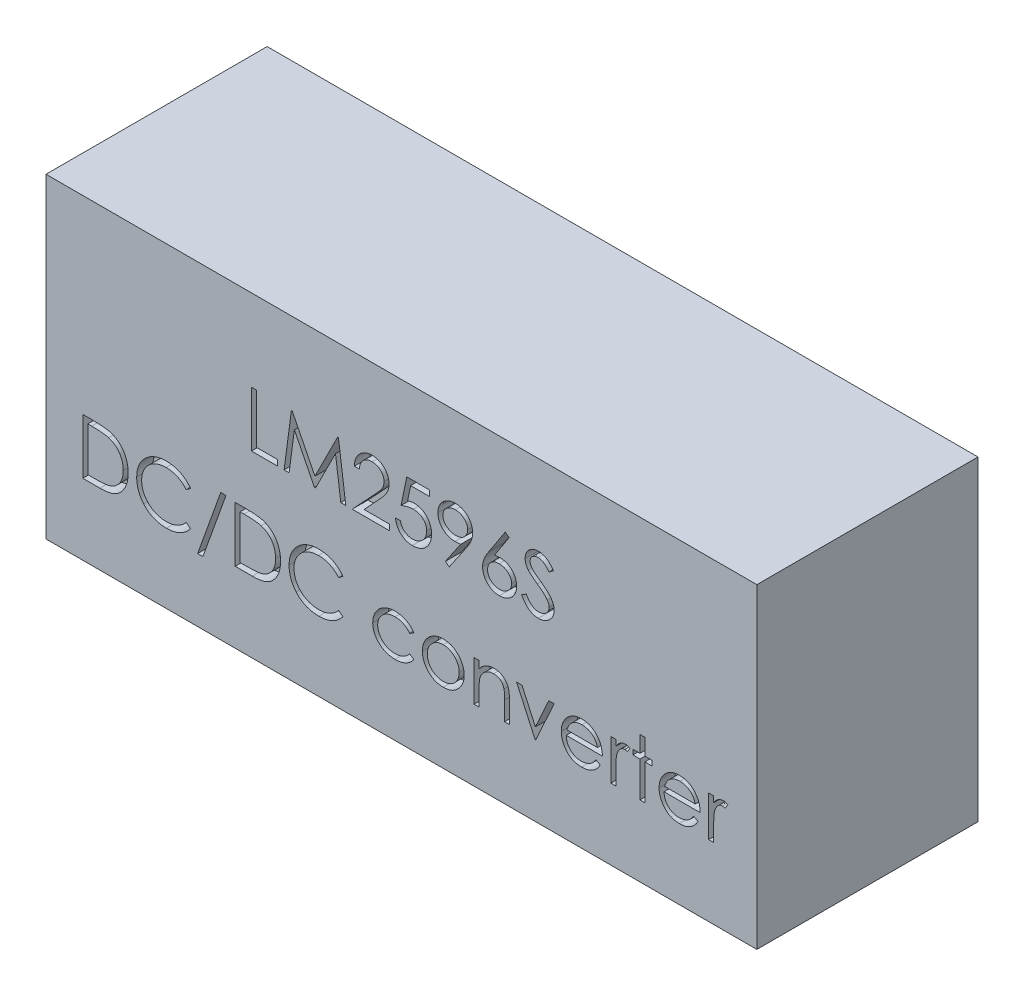
from build123d import *

# Parameters (mm, degrees)
SKETCH_2_W          = 45
SKETCH_2_H          = 20
EXTRUDE_1_DEPTH     = 14
CUT_EXTRUDE_1_DEPTH = 1


with BuildPart() as part:
    # 스케치2 → 보스-돌출1 (new body)
    with BuildSketch(Plane.XY):
        Rectangle(SKETCH_2_W, SKETCH_2_H)
    extrude(amount=EXTRUDE_1_DEPTH)

    # 스케치3 → 컷-돌출1 (cut)
    # profile 1 of 21: a face of its own
    with BuildSketch(Plane.XY.offset(14)):
        Polygon((-9.490384615, 4.829230769), (-9.176282051, 4.829230769), (-9.176282051, 1.688205128), (-7.830128205, 1.688205128), (-7.830128205, 1.329230769), (-9.490384615, 1.329230769), align=None)
    # profile 2 of 21: a face of its own
    with BuildSketch(Plane.XY.offset(14)):
        Polygon((-7.426282051, 1.329230769), (-6.964242788, 4.829230769), (-6.919370994, 4.829230769), (-5.474358974, 1.957435897), (-4.032852564, 4.829230769), (-3.987279647, 4.829230769), (-3.522435897, 1.329230769), (-3.837940705, 1.329230769), (-4.173076923, 3.847660256), (-5.436498397, 1.329230769), (-5.507311699, 1.329230769), (-6.775641026, 3.853269231), (-7.110076122, 1.329230769), align=None)
    # profile 3 of 21: a face of its own
    with BuildSketch(Plane.XY.offset(14)):
        with BuildLine():
            Line((-2.669871795, 3.752307692), (-2.983974359, 3.752307692))
            add(Edge.make_bspline(
                [(-2.983974359, 3.752307692), (-2.981927206, 3.79397858), (-2.977906652, 3.875819095), (-2.959078363, 3.995143001), (-2.932137485, 4.1091978), (-2.894046031, 4.217067714), (-2.846739754, 4.319706521), (-2.790009726, 4.416706537), (-2.722815876, 4.507697725), (-2.646609142, 4.591836569), (-2.563840503, 4.669024139), (-2.474534563, 4.735679382), (-2.380689536, 4.791997054), (-2.282590137, 4.839078295), (-2.179129573, 4.874418141), (-2.071246716, 4.900639781), (-1.958467579, 4.916416127), (-1.881627557, 4.918111912), (-1.842548077, 4.918974359)],
                knots=[0, 0, 0, 0, 1.10065271, 2.161652631, 3.183658789, 4.190468796, 5.17591951, 6.163126047, 7.15150782, 8.156236427, 9.156009102, 10.134482811, 11.092018607, 12.041330605, 13.001268258, 13.972401359, 14.968799086, 16, 16, 16, 16], degree=3))
            add(Edge.make_bspline(
                [(-1.842548077, 4.918974359), (-1.804170003, 4.918075903), (-1.728758458, 4.916310468), (-1.618696444, 4.901149438), (-1.513919149, 4.877403847), (-1.414631383, 4.84408843), (-1.321625318, 4.799304003), (-1.234202274, 4.745506464), (-1.151321463, 4.683286633), (-1.076714679, 4.61003282), (-1.0082066, 4.531830435), (-0.949104345, 4.448342532), (-0.898491181, 4.362113246), (-0.856303501, 4.272485044), (-0.825247363, 4.178614016), (-0.801669155, 4.081866813), (-0.788341741, 3.981242002), (-0.786296317, 3.913135446), (-0.78525641, 3.878509615)],
                knots=[0, 0, 0, 0, 1.111607364, 2.184268762, 3.212621178, 4.221274766, 5.211760367, 6.196651075, 7.1921475, 8.207485113, 9.220403448, 10.201281604, 11.166441695, 12.114753415, 13.065576456, 14.026450734, 14.996634279, 16, 16, 16, 16], degree=3))
            add(Edge.make_bspline(
                [(-0.78525641, 3.878509615), (-0.786949673, 3.829761781), (-0.790306484, 3.733121567), (-0.819020861, 3.591106704), (-0.863867372, 3.453513285), (-0.917864729, 3.342775983), (-0.972337173, 3.253542489), (-1.021424681, 3.180073785), (-1.078889492, 3.100968316), (-1.14556799, 3.016490979), (-1.220080862, 2.925980074), (-1.303103025, 2.829490278), (-1.395226507, 2.728018508), (-1.459885008, 2.658712907), (-1.493389423, 2.622800481)],
                knots=[0, 0, 0, 0, 1.184426356, 2.348067706, 3.509069118, 4.696110526, 5.333549288, 6.050745305, 6.844228056, 7.710549037, 8.667450064, 9.695053472, 10.805634456, 12, 12, 12, 12], degree=3))
            Line((-1.493389423, 2.622800481), (-2.369090545, 1.688205128))
            Line((-2.369090545, 1.688205128), (-0.740384615, 1.688205128))
            Line((-0.740384615, 1.688205128), (-0.740384615, 1.329230769))
            Line((-0.740384615, 1.329230769), (-3.118589744, 1.329230769))
            Line((-3.118589744, 1.329230769), (-1.761217949, 2.777748397))
            add(Edge.make_bspline(
                [(-1.761217949, 2.777748397), (-1.728170062, 2.812246704), (-1.664691835, 2.878510891), (-1.574909258, 2.975253851), (-1.49427027, 3.065003391), (-1.422252877, 3.14758994), (-1.360419372, 3.224221508), (-1.30554714, 3.292416211), (-1.261581549, 3.355170662), (-1.213866153, 3.427911276), (-1.167652172, 3.516723593), (-1.127939815, 3.625257282), (-1.103724967, 3.736984535), (-1.100820132, 3.812486572), (-1.099358974, 3.850464744)],
                knots=[0, 0, 0, 0, 1.329631726, 2.553950428, 3.673215718, 4.687767853, 5.603093632, 6.413772471, 7.123043292, 7.734684054, 8.834405432, 9.900288307, 10.943827018, 12, 12, 12, 12], degree=3))
            add(Edge.make_bspline(
                [(-1.099358974, 3.850464744), (-1.099994717, 3.874346142), (-1.101247643, 3.921411792), (-1.11230534, 3.990417551), (-1.129015846, 4.056982365), (-1.152961104, 4.121310984), (-1.184567844, 4.182756636), (-1.223041224, 4.241394117), (-1.267431288, 4.298083082), (-1.318782557, 4.35123638), (-1.375194077, 4.399917585), (-1.434788326, 4.443041671), (-1.497838431, 4.479080782), (-1.564078553, 4.508624279), (-1.633324022, 4.53179966), (-1.705708767, 4.547858239), (-1.781032784, 4.557940723), (-1.832466279, 4.559304895), (-1.858673878, 4.56)],
                knots=[0, 0, 0, 0, 0.991446411, 1.95395049, 2.89581595, 3.838931463, 4.798493298, 5.75982156, 6.748411868, 7.785213223, 8.824556874, 9.840280684, 10.836137867, 11.835679398, 12.848801643, 13.863922112, 14.911575587, 16, 16, 16, 16], degree=3))
            add(Edge.make_bspline(
                [(-1.858673878, 4.56), (-1.886044711, 4.559284968), (-1.939796507, 4.557880762), (-2.01871554, 4.548058098), (-2.094001318, 4.531112258), (-2.165843221, 4.507935584), (-2.234362806, 4.478477035), (-2.29922685, 4.44178529), (-2.36028974, 4.398001797), (-2.417666263, 4.348361241), (-2.470530242, 4.293093639), (-2.516977118, 4.231483676), (-2.557561132, 4.164656261), (-2.592970366, 4.09279171), (-2.621726056, 4.01523793), (-2.643699206, 3.932270226), (-2.661086053, 3.844248844), (-2.666894573, 3.783463759), (-2.669871795, 3.752307692)],
                knots=[0, 0, 0, 0, 1.031018746, 2.02475058, 2.990194455, 3.934040569, 4.864654155, 5.795059489, 6.735614925, 7.690564532, 8.649604399, 9.611025574, 10.590972636, 11.591080095, 12.624614302, 13.701020113, 14.821632451, 16, 16, 16, 16], degree=3))
        make_face()
    # profile 4 of 21: a face of its own
    with BuildSketch(Plane.XY.offset(14)):
        with BuildLine():
            Line((1.772435897, 4.829230769), (1.772435897, 4.47025641))
            Line((1.772435897, 4.47025641), (0.58193109, 4.47025641))
            Line((0.58193109, 4.47025641), (0.393329327, 3.549683494))
            add(Edge.make_bspline(
                [(0.393329327, 3.549683494), (0.430385201, 3.559913765), (0.502175097, 3.579733299), (0.608134958, 3.601739069), (0.708727162, 3.615004513), (0.774002532, 3.616815824), (0.805588942, 3.617692308)],
                knots=[0, 0, 0, 0, 1.100273476, 2.13160584, 3.095893838, 4, 4, 4, 4], degree=3))
            add(Edge.make_bspline(
                [(0.805588942, 3.617692308), (0.844672682, 3.616846372), (0.921521079, 3.615183051), (1.033960026, 3.599211202), (1.14129292, 3.574071287), (1.24329529, 3.538950765), (1.34015584, 3.494041032), (1.430983402, 3.437941092), (1.517141315, 3.372407761), (1.597083909, 3.297062749), (1.669608217, 3.214141132), (1.733374207, 3.124983261), (1.787536797, 3.030455599), (1.831097552, 2.92965499), (1.865881886, 2.823695837), (1.889033881, 2.711463254), (1.90445059, 2.594015134), (1.906172976, 2.513710564), (1.907051282, 2.472760417)],
                knots=[0, 0, 0, 0, 1.052922333, 2.070308379, 3.05430497, 4.020497103, 4.973039431, 5.925935799, 6.892292201, 7.88610001, 8.88166317, 9.857072816, 10.836096531, 11.812156883, 12.81219415, 13.836441305, 14.89672472, 16, 16, 16, 16], degree=3))
            add(Edge.make_bspline(
                [(1.907051282, 2.472760417), (1.906386207, 2.444238196), (1.905065044, 2.387579209), (1.898346457, 2.303435008), (1.88541074, 2.221072175), (1.868043016, 2.140479783), (1.845500598, 2.061810411), (1.818211544, 1.984838883), (1.784815517, 1.910044276), (1.748184142, 1.836718881), (1.706937664, 1.766520374), (1.661159156, 1.700871388), (1.612793665, 1.638787106), (1.56075228, 1.580933373), (1.504551285, 1.527690355), (1.444871318, 1.478742074), (1.382188599, 1.433260743), (1.315533356, 1.393092548), (1.246390873, 1.356129592), (1.173762656, 1.325806055), (1.099301956, 1.298695527), (1.02193708, 1.277085999), (0.941843268, 1.260153444), (0.858888492, 1.248652844), (0.773507822, 1.240276406), (0.715632809, 1.239752049), (0.686398237, 1.239487179)],
                knots=[0, 0, 0, 0, 1.056347294, 2.098418968, 3.122841568, 4.141288669, 5.149314143, 6.15115421, 7.162517403, 8.180376062, 9.185164535, 10.17417709, 11.141909838, 12.097768115, 13.052685741, 14.0056014, 14.954263652, 15.917497458, 16.885230207, 17.854509472, 18.828990115, 19.81800267, 20.826176721, 21.857883937, 22.917946725, 24, 24, 24, 24], degree=3))
            add(Edge.make_bspline(
                [(0.686398237, 1.239487179), (0.651524056, 1.240178017), (0.582913226, 1.24153716), (0.482392659, 1.255755645), (0.385678053, 1.276119561), (0.293547952, 1.306755831), (0.205176688, 1.345143126), (0.12175397, 1.393659297), (0.041148194, 1.448638401), (-0.033363842, 1.513518754), (-0.102519956, 1.584434436), (-0.164426465, 1.661392077), (-0.219560042, 1.743121519), (-0.267037789, 1.830019673), (-0.30753581, 1.921858204), (-0.339350798, 2.018981205), (-0.365029153, 2.120881209), (-0.375892574, 2.19103472), (-0.381410256, 2.226666667)],
                knots=[0, 0, 0, 0, 1.0467383, 2.05933395, 3.04377827, 4.011590433, 4.970194871, 5.932262533, 6.905835911, 7.896367577, 8.894135286, 9.877477877, 10.858688626, 11.851381753, 12.8477658, 13.868841284, 14.917554742, 16, 16, 16, 16], degree=3))
            Line((-0.381410256, 2.226666667), (-0.067307692, 2.226666667))
            add(Edge.make_bspline(
                [(-0.067307692, 2.226666667), (-0.059579135, 2.193290214), (-0.044724418, 2.129138819), (-0.01211867, 2.039007478), (0.027747206, 1.958688254), (0.075151554, 1.887118671), (0.131701585, 1.824709674), (0.196231014, 1.769092612), (0.268578737, 1.718917483), (0.348971966, 1.677094715), (0.433785046, 1.641425962), (0.522552256, 1.617674267), (0.612856602, 1.600973374), (0.673934972, 1.599301613), (0.704627404, 1.598461538)],
                knots=[0, 0, 0, 0, 1.136247022, 2.183929868, 3.172523383, 4.106158343, 5.02341133, 5.958108904, 6.928429099, 7.938127109, 8.96079061, 9.975095812, 10.982467395, 12, 12, 12, 12], degree=3))
            add(Edge.make_bspline(
                [(0.704627404, 1.598461538), (0.734585848, 1.599282316), (0.79357427, 1.600898435), (0.880385657, 1.613337447), (0.964198531, 1.632495018), (1.044185888, 1.661164873), (1.121747428, 1.696009592), (1.194921198, 1.740724667), (1.265824075, 1.792184686), (1.332252209, 1.851141316), (1.393091658, 1.916111011), (1.446847779, 1.985588404), (1.491624693, 2.05970525), (1.529358801, 2.137178403), (1.5580121, 2.218856961), (1.578453082, 2.304358136), (1.59045614, 2.393893116), (1.59210732, 2.454962426), (1.592948718, 2.486081731)],
                knots=[0, 0, 0, 0, 1.027316725, 2.022795036, 3.002884548, 3.971462791, 4.93288096, 5.914575861, 6.907176829, 7.935150275, 8.956128384, 9.956726525, 10.942570165, 11.921478529, 12.907843606, 13.90538589, 14.932640048, 16, 16, 16, 16], degree=3))
            add(Edge.make_bspline(
                [(1.592948718, 2.486081731), (1.592290238, 2.514157482), (1.591001359, 2.569111771), (1.580470788, 2.649510978), (1.562153816, 2.72558402), (1.536729936, 2.797698254), (1.504450428, 2.865921697), (1.465004116, 2.930324757), (1.417650718, 2.99005859), (1.363558829, 3.045151144), (1.304300789, 3.095996018), (1.238857046, 3.139340105), (1.168597119, 3.175804023), (1.09436752, 3.207272021), (1.014402621, 3.229872766), (0.930285989, 3.246840652), (0.841109281, 3.256656014), (0.780138593, 3.258017903), (0.748798077, 3.258717949)],
                knots=[0, 0, 0, 0, 1.045622112, 2.046656509, 3.013763289, 3.955457236, 4.890082067, 5.820317437, 6.762574623, 7.722996705, 8.69280354, 9.665887285, 10.63943826, 11.638615906, 12.663482002, 13.728887084, 14.832589034, 16, 16, 16, 16], degree=3))
            add(Edge.make_bspline(
                [(0.748798077, 3.258717949), (0.721669148, 3.258137358), (0.665654793, 3.256938584), (0.579731966, 3.248112087), (0.489440243, 3.233872793), (0.395125748, 3.214286545), (0.296505239, 3.188655469), (0.193786839, 3.157940968), (0.086754572, 3.121218969), (0.014636848, 3.093486756), (-0.022435897, 3.079230769)],
                knots=[0, 0, 0, 0, 0.817624296, 1.688186739, 2.600797293, 3.572016777, 4.590301741, 5.671205678, 6.80286297, 8, 8, 8, 8], degree=3))
            Line((-0.022435897, 3.079230769), (0.336538462, 4.829230769))
            Line((0.336538462, 4.829230769), (1.772435897, 4.829230769))
        make_face()
    # profile 5 of 21: a face of its own
    with BuildSketch(Plane.XY.offset(14)):
        with BuildLine():
            Line((3.028846154, 1.239487179), (2.777844551, 1.414066506))
            Line((2.777844551, 1.414066506), (3.751001603, 2.836642628))
            add(Edge.make_bspline(
                [(3.751001603, 2.836642628), (3.688910867, 2.829049565), (3.566650747, 2.8140984), (3.443513645, 2.811351745), (3.38291266, 2.81)],
                knots=[0, 0, 0, 0, 1.015715272, 2, 2, 2, 2], degree=3))
            add(Edge.make_bspline(
                [(3.38291266, 2.81), (3.346170612, 2.810941076), (3.274049186, 2.812788327), (3.168017533, 2.827430136), (3.066131973, 2.849980263), (2.968662617, 2.883629018), (2.875243112, 2.925447227), (2.786077398, 2.977304241), (2.701285508, 3.038310533), (2.621778098, 3.108143524), (2.549466359, 3.184821577), (2.485043061, 3.26597722), (2.431501929, 3.35255319), (2.387025344, 3.44278341), (2.35329489, 3.537964761), (2.328732353, 3.637014161), (2.313609998, 3.740625803), (2.311810903, 3.811150934), (2.310897436, 3.846959135)],
                knots=[0, 0, 0, 0, 1.060718605, 2.082097864, 3.085795603, 4.069760067, 5.054557537, 6.03741023, 7.043284206, 8.066802108, 9.088538119, 10.083643548, 11.053783639, 12.022749082, 12.983451788, 13.964007469, 14.966251758, 16, 16, 16, 16], degree=3))
            add(Edge.make_bspline(
                [(2.310897436, 3.846959135), (2.312631871, 3.895927787), (2.316036214, 3.992043319), (2.343434732, 4.132477088), (2.388495071, 4.265263632), (2.451323448, 4.390053825), (2.530458169, 4.505052565), (2.625566759, 4.608661174), (2.736070723, 4.699406028), (2.859452743, 4.777410105), (2.992805763, 4.840145102), (3.132474421, 4.886384403), (3.277388541, 4.913583151), (3.375556212, 4.917169012), (3.424979968, 4.918974359)],
                knots=[0, 0, 0, 0, 1.022988612, 2.007919123, 2.978103895, 3.94594894, 4.918897164, 5.887013414, 6.875921846, 7.89917871, 8.930658928, 9.948724884, 10.967259574, 12, 12, 12, 12], degree=3))
            add(Edge.make_bspline(
                [(3.424979968, 4.918974359), (3.473468388, 4.917144196), (3.569276934, 4.913527966), (3.710165941, 4.887043997), (3.845106958, 4.842407324), (3.973351945, 4.780722761), (4.092091357, 4.703401853), (4.198867168, 4.611267329), (4.291242707, 4.504261802), (4.369066588, 4.384973312), (4.431536628, 4.256806331), (4.476608911, 4.123022408), (4.50435455, 3.984583687), (4.507850877, 3.890789213), (4.509615385, 3.843453526)],
                knots=[0, 0, 0, 0, 1.026385292, 2.028040595, 3.023318987, 4.028184125, 5.03290303, 6.015178782, 7.004435299, 8.016004309, 9.023023918, 10.015172535, 10.998308025, 12, 12, 12, 12], degree=3))
            add(Edge.make_bspline(
                [(4.509615385, 3.843453526), (4.508436976, 3.806709758), (4.506046868, 3.732184218), (4.489310561, 3.618953875), (4.460890376, 3.503502646), (4.428638677, 3.40578105), (4.397506509, 3.3250726), (4.368205378, 3.26132102), (4.335693224, 3.194219757), (4.297774459, 3.124472419), (4.257012162, 3.051189884), (4.210952885, 2.975107168), (4.160647313, 2.896122175), (4.124817594, 2.842875087), (4.106470353, 2.815608974)],
                knots=[0, 0, 0, 0, 1.179839688, 2.393009684, 3.667231171, 4.993948276, 5.694988576, 6.444077775, 7.246288328, 8.089075292, 8.993003841, 9.939041771, 10.944649915, 12, 12, 12, 12], degree=3))
            Line((4.106470353, 2.815608974), (3.028846154, 1.239487179))
        make_face()
        with BuildLine():
            add(Edge.make_bspline(
                [(3.441105769, 3.168974359), (3.468939783, 3.169734743), (3.523123146, 3.171214951), (3.602500445, 3.180224193), (3.677424649, 3.196198179), (3.748095898, 3.219117891), (3.8152228, 3.24677456), (3.877739128, 3.281986546), (3.935697204, 3.324003181), (3.989485131, 3.371213197), (4.03724913, 3.423663781), (4.079792161, 3.478560887), (4.115952728, 3.536145497), (4.144516005, 3.59713876), (4.168000581, 3.660055968), (4.184218593, 3.725910323), (4.193202926, 3.794358724), (4.194734501, 3.840857382), (4.195512821, 3.864487179)],
                knots=[0, 0, 0, 0, 1.163407946, 2.26475976, 3.333800367, 4.359385343, 5.366239384, 6.363380779, 7.350133999, 8.353570782, 9.349036268, 10.310270964, 11.253520213, 12.184142, 13.120487599, 14.056272588, 15.012232024, 16, 16, 16, 16], degree=3))
            add(Edge.make_bspline(
                [(4.195512821, 3.864487179), (4.194843151, 3.888126845), (4.193523486, 3.934711705), (4.182936186, 4.003261445), (4.164310963, 4.068954705), (4.139320479, 4.132151135), (4.106400241, 4.192331507), (4.066896755, 4.250251379), (4.019964305, 4.305543507), (3.965961739, 4.35690749), (3.907727186, 4.40425539), (3.845666686, 4.446041466), (3.78029177, 4.481062662), (3.71200128, 4.509961632), (3.640652931, 4.532513407), (3.566288943, 4.548730772), (3.488533537, 4.557702527), (3.435752251, 4.559224421), (3.408854167, 4.56)],
                knots=[0, 0, 0, 0, 0.972161553, 1.915763587, 2.844109794, 3.775983486, 4.705125789, 5.659731448, 6.655561913, 7.682237399, 8.721216875, 9.739758359, 10.754845918, 11.767244016, 12.7857855, 13.828538656, 14.893392813, 16, 16, 16, 16], degree=3))
            add(Edge.make_bspline(
                [(3.408854167, 4.56), (3.382190013, 4.559223168), (3.329875164, 4.557699031), (3.252811005, 4.548747826), (3.178949837, 4.532404342), (3.107808216, 4.509972078), (3.039519756, 4.481060506), (2.974147923, 4.446039631), (2.912072906, 4.404265008), (2.853894186, 4.356870236), (2.799796264, 4.30578259), (2.753670735, 4.250009161), (2.714076842, 4.192361636), (2.68120184, 4.132143128), (2.656199322, 4.068956842), (2.637577321, 4.003260866), (2.626989155, 3.934711856), (2.625669609, 3.888126895), (2.625, 3.864487179)],
                knots=[0, 0, 0, 0, 1.099389452, 2.15699305, 3.192601482, 4.213358962, 5.227959689, 6.245255729, 7.266013209, 8.307253147, 9.336162325, 10.327954924, 11.284637477, 12.215801273, 13.149702402, 14.080068371, 15.025723358, 16, 16, 16, 16], degree=3))
            add(Edge.make_bspline(
                [(2.625, 3.864487179), (2.625605926, 3.840838981), (2.626800923, 3.794200405), (2.638328713, 3.725674012), (2.657606993, 3.659985818), (2.683426383, 3.596497111), (2.717427974, 3.535825253), (2.759151822, 3.478257891), (2.808057368, 3.42314244), (2.863490855, 3.371335229), (2.924159016, 3.323783053), (2.988955762, 3.282252671), (3.056765599, 3.247180227), (3.12782723, 3.219038843), (3.20161403, 3.196427179), (3.278789161, 3.180253634), (3.359097399, 3.171301367), (3.413507381, 3.16975747), (3.441105769, 3.168974359)],
                knots=[0, 0, 0, 0, 0.952633368, 1.87876736, 2.791047057, 3.707742249, 4.635551637, 5.587206343, 6.568248508, 7.601284464, 8.641511608, 9.671105535, 10.699146789, 11.713763218, 12.747829548, 13.806491675, 14.887386225, 16, 16, 16, 16], degree=3))
        make_face(mode=Mode.SUBTRACT)
    # profile 6 of 21: a face of its own
    with BuildSketch(Plane.XY.offset(14)):
        with BuildLine():
            Line((6.573717949, 4.918974359), (6.815604968, 4.728970353))
            Line((6.815604968, 4.728970353), (5.890825321, 3.314807692))
            add(Edge.make_bspline(
                [(5.890825321, 3.314807692), (5.952395597, 3.324621553), (6.072495384, 3.343764598), (6.194061283, 3.346922543), (6.253305288, 3.348461538)],
                knots=[0, 0, 0, 0, 1.025318673, 2, 2, 2, 2], degree=3))
            add(Edge.make_bspline(
                [(6.253305288, 3.348461538), (6.288877785, 3.347505427), (6.358901185, 3.345623349), (6.461707987, 3.331139499), (6.560496923, 3.308314387), (6.654858536, 3.275042131), (6.745131518, 3.232539776), (6.831833914, 3.181600906), (6.913335924, 3.119595226), (6.990687103, 3.05033027), (7.0609142, 2.973613286), (7.123090256, 2.892211949), (7.175317048, 2.806211068), (7.217690969, 2.715654202), (7.250595848, 2.620680942), (7.274583493, 2.521412803), (7.288763086, 2.417781331), (7.290688576, 2.347303156), (7.291666667, 2.311502404)],
                knots=[0, 0, 0, 0, 1.04369286, 2.054478336, 3.041073146, 4.015093852, 4.984733326, 5.965804835, 6.960378782, 7.985147595, 9.009457201, 10.008161701, 10.986880575, 11.956520048, 12.937015923, 13.931873656, 14.949455224, 16, 16, 16, 16], degree=3))
            add(Edge.make_bspline(
                [(7.291666667, 2.311502404), (7.290243562, 2.2625227), (7.287443228, 2.166142234), (7.259539432, 2.025765528), (7.216179787, 1.892033012), (7.154202259, 1.767079841), (7.077219876, 1.651077271), (6.983342283, 1.548291806), (6.875898795, 1.456621768), (6.754411997, 1.379965149), (6.623669033, 1.317362098), (6.486317035, 1.272396856), (6.343689889, 1.244713387), (6.246885281, 1.241242784), (6.197916667, 1.239487179)],
                knots=[0, 0, 0, 0, 1.031375318, 2.029502543, 3.004789286, 3.987476834, 4.960371455, 5.9300674, 6.912260825, 7.929083631, 8.949397511, 9.960523116, 10.96833055, 12, 12, 12, 12], degree=3))
            add(Edge.make_bspline(
                [(6.197916667, 1.239487179), (6.150819966, 1.241015385), (6.057529648, 1.244042493), (5.920296854, 1.271008431), (5.788433836, 1.314715534), (5.662864456, 1.374929812), (5.546543843, 1.450987695), (5.442478206, 1.542549975), (5.351186432, 1.64765944), (5.275211811, 1.766299787), (5.214953079, 1.893789744), (5.169763154, 2.026726901), (5.14336691, 2.164626882), (5.139678354, 2.258108022), (5.137820513, 2.305192308)],
                knots=[0, 0, 0, 0, 1.012016664, 2.004627821, 2.994792927, 3.992885782, 4.990978636, 5.973936114, 6.964471063, 7.975201453, 8.993600317, 9.990122807, 10.98767138, 12, 12, 12, 12], degree=3))
            add(Edge.make_bspline(
                [(5.137820513, 2.305192308), (5.139001958, 2.341236891), (5.141414243, 2.414833043), (5.158257633, 2.526297071), (5.185322428, 2.640348153), (5.215632674, 2.737102346), (5.247658284, 2.816363868), (5.274310824, 2.880267359), (5.30748482, 2.946028432), (5.342858201, 3.015902068), (5.38361507, 3.088087501), (5.427930719, 3.16379117), (5.47703037, 3.241809098), (5.511450533, 3.294753293), (5.529046474, 3.32181891)],
                knots=[0, 0, 0, 0, 1.173818275, 2.396712641, 3.66331629, 4.989737886, 5.693666774, 6.447286557, 7.243889047, 8.091586357, 8.998013824, 9.943181721, 10.948533338, 12, 12, 12, 12], degree=3))
            Line((5.529046474, 3.32181891), (6.573717949, 4.918974359))
        make_face()
        with BuildLine():
            add(Edge.make_bspline(
                [(6.18739984, 2.989487179), (6.160737595, 2.988709136), (6.108658486, 2.98718939), (6.032251071, 2.978364139), (5.959937819, 2.961745073), (5.890760686, 2.940578741), (5.826012983, 2.911475681), (5.765224143, 2.876123882), (5.708159091, 2.834502704), (5.655415539, 2.787201793), (5.607595876, 2.73541376), (5.566414745, 2.679944238), (5.530892345, 2.622130035), (5.502010526, 2.561488093), (5.47952045, 2.498041593), (5.4632522, 2.432082344), (5.454198448, 2.363168038), (5.452692217, 2.316435535), (5.451923077, 2.292572115)],
                knots=[0, 0, 0, 0, 1.129588631, 2.206414736, 3.251139165, 4.268635594, 5.265702196, 6.250456724, 7.242448911, 8.251968645, 9.246821453, 10.222880186, 11.173611482, 12.116736599, 13.062300278, 14.020270554, 14.989073742, 16, 16, 16, 16], degree=3))
            add(Edge.make_bspline(
                [(5.451923077, 2.292572115), (5.452549438, 2.268922136), (5.45377764, 2.222548046), (5.46492996, 2.154208866), (5.481965042, 2.088443958), (5.507305438, 2.025592359), (5.537532326, 1.964696041), (5.57743765, 1.907960755), (5.621654436, 1.851940685), (5.67450837, 1.800939214), (5.731231733, 1.75348259), (5.791832935, 1.712002336), (5.854992895, 1.676516163), (5.921564317, 1.648705065), (5.990602701, 1.625880778), (6.062683255, 1.609819299), (6.137856111, 1.600738773), (6.188778049, 1.59923058), (6.21474359, 1.598461538)],
                knots=[0, 0, 0, 0, 0.989467248, 1.94019797, 2.891935182, 3.827694429, 4.772920941, 5.730924762, 6.725747692, 7.756678648, 8.79901574, 9.819492441, 10.826891316, 11.826466727, 12.835195252, 13.867842842, 14.912794438, 16, 16, 16, 16], degree=3))
            add(Edge.make_bspline(
                [(6.21474359, 1.598461538), (6.240709088, 1.59923064), (6.291630943, 1.600738952), (6.366804403, 1.609818621), (6.438882722, 1.625883268), (6.50792923, 1.648696039), (6.574470661, 1.676549648), (6.637575383, 1.711781568), (6.697603476, 1.753737686), (6.754364076, 1.800858114), (6.806998014, 1.852230966), (6.852275293, 1.907460688), (6.890958526, 1.965154584), (6.922392714, 2.025352474), (6.947454005, 2.088481961), (6.964575472, 2.154198685), (6.975704761, 2.222550711), (6.976936127, 2.268923036), (6.977564103, 2.292572115)],
                knots=[0, 0, 0, 0, 1.087397944, 2.132534446, 3.165364764, 4.174271784, 5.174024072, 6.181601208, 7.194203697, 8.236725232, 9.267838612, 10.269026844, 11.221737037, 12.171628256, 13.107553087, 14.05945871, 15.010357665, 16, 16, 16, 16], degree=3))
            add(Edge.make_bspline(
                [(6.977564103, 2.292572115), (6.97701381, 2.316466666), (6.975933763, 2.363363899), (6.963717815, 2.432051517), (6.946775441, 2.498376723), (6.92119241, 2.561922672), (6.887955865, 2.6224386), (6.847472458, 2.6802302), (6.800639888, 2.735740548), (6.746542349, 2.787303356), (6.687652115, 2.834450434), (6.625036529, 2.87606999), (6.559528556, 2.911194967), (6.491194613, 2.940502069), (6.41925173, 2.961651544), (6.344861391, 2.978304787), (6.267072149, 2.987166804), (6.21429554, 2.98870387), (6.18739984, 2.989487179)],
                knots=[0, 0, 0, 0, 0.978206639, 1.919901502, 2.851605144, 3.780102724, 4.718870031, 5.675451981, 6.667674623, 7.690630536, 8.733308323, 9.756129687, 10.767539656, 11.776269907, 12.797430371, 13.836405707, 14.897401972, 16, 16, 16, 16], degree=3))
        make_face(mode=Mode.SUBTRACT)
    # profile 7 of 21: a face of its own
    with BuildSketch(Plane.XY.offset(14)):
        with BuildLine():
            Line((7.605769231, 2.004411058), (7.901642628, 2.181794872))
            add(Edge.make_bspline(
                [(7.901642628, 2.181794872), (7.929160865, 2.135730487), (7.981884746, 2.047472903), (8.069836105, 1.928214863), (8.160969016, 1.826852706), (8.25595835, 1.743976098), (8.354224298, 1.678727211), (8.456408352, 1.63252498), (8.562166163, 1.603709004), (8.634139984, 1.600208918), (8.670072115, 1.598461538)],
                knots=[0, 0, 0, 0, 1.272034388, 2.437168799, 3.508375237, 4.49857839, 5.41946034, 6.295179144, 7.148887113, 8, 8, 8, 8], degree=3))
            add(Edge.make_bspline(
                [(8.670072115, 1.598461538), (8.700758976, 1.599316211), (8.761595749, 1.601010601), (8.851157992, 1.617291403), (8.938139794, 1.642303532), (9.020748432, 1.678124464), (9.097844046, 1.721462949), (9.165450742, 1.773809127), (9.223896855, 1.832415333), (9.27170597, 1.897797987), (9.308386005, 1.968115136), (9.336578073, 2.040291087), (9.352223147, 2.115459656), (9.3545799, 2.166070118), (9.355769231, 2.191610577)],
                knots=[0, 0, 0, 0, 1.095163259, 2.171163733, 3.241058638, 4.321873601, 5.38011039, 6.391990106, 7.366004449, 8.327778327, 9.272591725, 10.192022065, 11.087607919, 12, 12, 12, 12], degree=3))
            add(Edge.make_bspline(
                [(9.355769231, 2.191610577), (9.35429492, 2.220751427), (9.351297862, 2.279990516), (9.325966382, 2.367390169), (9.286117135, 2.453882739), (9.249354491, 2.507384004), (9.230268429, 2.535160256)],
                knots=[0, 0, 0, 0, 0.938893495, 1.908633276, 2.914225137, 4, 4, 4, 4], degree=3))
            add(Edge.make_bspline(
                [(9.230268429, 2.535160256), (9.214597815, 2.55520708), (9.181699321, 2.597292879), (9.125141808, 2.659938114), (9.058775694, 2.724556533), (8.984872139, 2.79361559), (8.90073905, 2.863903387), (8.809011536, 2.938771665), (8.707347677, 3.015373242), (8.63604818, 3.066745807), (8.599258814, 3.093253205)],
                knots=[0, 0, 0, 0, 0.722233717, 1.516239348, 2.393582979, 3.351407094, 4.387010283, 5.505090956, 6.712668013, 8, 8, 8, 8], degree=3))
            add(Edge.make_bspline(
                [(8.599258814, 3.093253205), (8.562434818, 3.119481793), (8.492030141, 3.169628855), (8.393571559, 3.244053139), (8.305527096, 3.312097009), (8.228288079, 3.374401021), (8.161888483, 3.430973625), (8.105805072, 3.481271565), (8.061466515, 3.526655125), (8.036810934, 3.556096467), (8.025741186, 3.569314904)],
                knots=[0, 0, 0, 0, 1.452282411, 2.77665338, 3.964542531, 5.026858415, 5.96415736, 6.766646006, 7.446254459, 8, 8, 8, 8], degree=3))
            add(Edge.make_bspline(
                [(8.025741186, 3.569314904), (8.010268641, 3.589915941), (7.979839804, 3.630430644), (7.939673798, 3.693755502), (7.905534636, 3.758578768), (7.878772304, 3.825074632), (7.856236085, 3.892309561), (7.841078154, 3.961160807), (7.831586757, 4.031319425), (7.830614771, 4.078532926), (7.830128205, 4.102167468)],
                knots=[0, 0, 0, 0, 1.068054152, 2.10047183, 3.106115577, 4.101338837, 5.06977816, 6.043150881, 7.020423561, 8, 8, 8, 8], degree=3))
            add(Edge.make_bspline(
                [(7.830128205, 4.102167468), (7.831433414, 4.139197243), (7.834015934, 4.212465306), (7.855856451, 4.319496137), (7.890329345, 4.421682554), (7.938624233, 4.518012888), (8.000881586, 4.605978869), (8.07292756, 4.686592356), (8.158739046, 4.754360938), (8.25289167, 4.813572996), (8.355948042, 4.859918921), (8.463938945, 4.894879901), (8.577036017, 4.914689159), (8.653639152, 4.917531924), (8.692508013, 4.918974359)],
                knots=[0, 0, 0, 0, 1.005424448, 1.989358655, 2.955360095, 3.929531133, 4.905563448, 5.876582895, 6.856512386, 7.866279853, 8.892233794, 9.918561126, 10.94386622, 12, 12, 12, 12], degree=3))
            add(Edge.make_bspline(
                [(8.692508013, 4.918974359), (8.733752113, 4.917551807), (8.815773465, 4.914722806), (8.93642268, 4.890125275), (9.052583397, 4.849424603), (9.146026662, 4.803235945), (9.219159423, 4.757104529), (9.274932156, 4.715084705), (9.331449607, 4.666709597), (9.389167661, 4.611850351), (9.447108321, 4.550003599), (9.506131773, 4.481592911), (9.566376042, 4.407036355), (9.605131902, 4.353811854), (9.625, 4.326526442)],
                knots=[0, 0, 0, 0, 1.286793592, 2.559021753, 3.825965368, 5.121522368, 5.803751409, 6.523245864, 7.299691795, 8.125521123, 9.008227632, 9.944561021, 10.946284179, 12, 12, 12, 12], degree=3))
            Line((9.625, 4.326526442), (9.341045673, 4.111282051))
            add(Edge.make_bspline(
                [(9.341045673, 4.111282051), (9.323899741, 4.133370742), (9.290880684, 4.175908395), (9.240751197, 4.235479711), (9.193502549, 4.28989619), (9.146952149, 4.337161318), (9.103558518, 4.379863451), (9.061441475, 4.416423208), (9.021207124, 4.447198804), (8.970490213, 4.480042364), (8.906772495, 4.512598867), (8.826787959, 4.540147945), (8.743201684, 4.556703007), (8.686272052, 4.558891895), (8.657451923, 4.56)],
                knots=[0, 0, 0, 0, 1.181633172, 2.275549214, 3.290209073, 4.226197932, 5.078386478, 5.862611352, 6.581680152, 7.217281963, 8.414376989, 9.595101626, 10.782541182, 12, 12, 12, 12], degree=3))
            add(Edge.make_bspline(
                [(8.657451923, 4.56), (8.621295401, 4.5587883), (8.551570953, 4.556451651), (8.452580717, 4.530931666), (8.363486792, 4.490749805), (8.286934227, 4.434434827), (8.22319725, 4.367713834), (8.177091791, 4.290934979), (8.149341627, 4.206152577), (8.145955347, 4.14701092), (8.144230769, 4.116891026)],
                knots=[0, 0, 0, 0, 1.14458467, 2.207223713, 3.21896685, 4.227309161, 5.202851033, 6.127160689, 7.046193047, 8, 8, 8, 8], degree=3))
            add(Edge.make_bspline(
                [(8.144230769, 4.116891026), (8.144623896, 4.098139547), (8.145410792, 4.060605928), (8.15638559, 4.005154506), (8.170484919, 3.949843166), (8.19282755, 3.894920583), (8.223672854, 3.839426224), (8.26417803, 3.782404487), (8.315191342, 3.723352778), (8.354268354, 3.684945404), (8.37489984, 3.664667468)],
                knots=[0, 0, 0, 0, 0.858281714, 1.717966888, 2.583508476, 3.4729293, 4.427298488, 5.488583878, 6.674047936, 8, 8, 8, 8], degree=3))
            add(Edge.make_bspline(
                [(8.37489984, 3.664667468), (8.382561212, 3.657830442), (8.400762879, 3.641587234), (8.434038805, 3.614994953), (8.477981603, 3.582192181), (8.531443804, 3.541604864), (8.595411166, 3.494523402), (8.669890722, 3.44154979), (8.754052255, 3.380964331), (8.813774171, 3.33860679), (8.845352564, 3.316209936)],
                knots=[0, 0, 0, 0, 0.420754252, 0.999615792, 1.744751191, 2.668019286, 3.750313428, 4.999500688, 6.413464383, 8, 8, 8, 8], degree=3))
            add(Edge.make_bspline(
                [(8.845352564, 3.316209936), (8.883338477, 3.288568576), (8.956892934, 3.235044915), (9.061550514, 3.154629235), (9.156444322, 3.075981466), (9.241907525, 2.999603859), (9.318784434, 2.926075766), (9.386222154, 2.854512586), (9.444907835, 2.785427013), (9.508087053, 2.696854437), (9.572644873, 2.588073353), (9.62808638, 2.454795114), (9.663044728, 2.320998794), (9.667616243, 2.231071957), (9.669871795, 2.186702724)],
                knots=[0, 0, 0, 0, 1.163667725, 2.253281268, 3.268753668, 4.215851969, 5.092017293, 5.902905408, 6.650798638, 7.335211899, 8.59617414, 9.77448103, 10.901945474, 12, 12, 12, 12], degree=3))
            add(Edge.make_bspline(
                [(9.669871795, 2.186702724), (9.669214657, 2.155324359), (9.667913142, 2.093176976), (9.652952228, 2.001921899), (9.631032563, 1.913291029), (9.597995329, 1.828379917), (9.557672171, 1.745635154), (9.506505923, 1.667227254), (9.447198238, 1.591420855), (9.379164473, 1.520237364), (9.304718571, 1.454891168), (9.226034876, 1.396762106), (9.142984603, 1.348293783), (9.056018286, 1.308742941), (8.96511595, 1.277809423), (8.870308166, 1.255396554), (8.771438655, 1.241640843), (8.704238173, 1.240213082), (8.670072115, 1.239487179)],
                knots=[0, 0, 0, 0, 0.983748083, 1.948392443, 2.894712957, 3.844097841, 4.80183111, 5.778335162, 6.776009319, 7.81870978, 8.863265674, 9.881300176, 10.883814829, 11.87499822, 12.874611388, 13.892143829, 14.928324115, 16, 16, 16, 16], degree=3))
            add(Edge.make_bspline(
                [(8.670072115, 1.239487179), (8.643636772, 1.239998361), (8.591099012, 1.241014286), (8.51338953, 1.249995567), (8.437249941, 1.26270267), (8.363635659, 1.28287674), (8.291598248, 1.307353718), (8.221451013, 1.33749205), (8.153159959, 1.373609252), (8.086342376, 1.414904276), (8.021168202, 1.462962021), (7.958248734, 1.518935517), (7.895519548, 1.581281022), (7.834832152, 1.651691586), (7.774959008, 1.729029668), (7.717080598, 1.814018852), (7.65999888, 1.906196206), (7.624183413, 1.971061291), (7.605769231, 2.004411058)],
                knots=[0, 0, 0, 0, 0.915332311, 1.819136955, 2.706846663, 3.586547465, 4.459518054, 5.340707479, 6.227863349, 7.133153174, 8.059268498, 9.028702269, 10.047606654, 11.120612155, 12.245963614, 13.433783089, 14.680604001, 16, 16, 16, 16], degree=3))
        make_face()
    # profile 8 of 21: a face of its own
    with BuildSketch(Plane.XY.offset(14)):
        with BuildLine():
            Line((-20.169871795, -5.504102564), (-20.169871795, -2.004102564))
            Line((-20.169871795, -2.004102564), (-19.463141026, -2.004102564))
            add(Edge.make_bspline(
                [(-19.463141026, -2.004102564), (-19.401672037, -2.004545134), (-19.282914272, -2.005400177), (-19.111301825, -2.010821568), (-18.952518062, -2.020412034), (-18.807085203, -2.03438156), (-18.674603991, -2.051534594), (-18.555445383, -2.073034998), (-18.44899324, -2.098423169), (-18.3835238, -2.120068619), (-18.352564103, -2.130304487)],
                knots=[0, 0, 0, 0, 1.314313732, 2.53924729, 3.670748893, 4.714932338, 5.66265055, 6.526160246, 7.303039223, 8, 8, 8, 8], degree=3))
            add(Edge.make_bspline(
                [(-18.352564103, -2.130304487), (-18.312069363, -2.145735193), (-18.231998171, -2.176246687), (-18.117991048, -2.233802988), (-18.010665685, -2.29901609), (-17.909446541, -2.371971953), (-17.816645714, -2.454736301), (-17.728637817, -2.543793387), (-17.649023094, -2.642381727), (-17.576114798, -2.748456715), (-17.510379138, -2.860768767), (-17.45323998, -2.979103876), (-17.405785987, -3.102861084), (-17.36639276, -3.231696232), (-17.335346303, -3.36589261), (-17.314164371, -3.505606476), (-17.300193381, -3.650285665), (-17.29878933, -3.748460129), (-17.298076923, -3.798273237)],
                knots=[0, 0, 0, 0, 0.984719456, 1.947108742, 2.898477687, 3.838006223, 4.779231079, 5.722358779, 6.681677486, 7.655904652, 8.64651281, 9.637519902, 10.640069247, 11.656948941, 12.698408672, 13.768548281, 14.867775369, 16, 16, 16, 16], degree=3))
            add(Edge.make_bspline(
                [(-17.298076923, -3.798273237), (-17.298705891, -3.841534476), (-17.299945337, -3.926785265), (-17.311074653, -4.05242616), (-17.327250973, -4.174339732), (-17.35229517, -4.291945432), (-17.382697684, -4.406273649), (-17.421661835, -4.516105894), (-17.466297331, -4.622449703), (-17.51834721, -4.723867179), (-17.575488595, -4.819950551), (-17.636810338, -4.91052608), (-17.702247033, -4.994301301), (-17.772422666, -5.071529913), (-17.846430383, -5.142095492), (-17.924754713, -5.206587507), (-18.007597764, -5.263744062), (-18.094588487, -5.31581117), (-18.188264616, -5.361231526), (-18.290400482, -5.399661536), (-18.40143166, -5.431508151), (-18.521085617, -5.458079047), (-18.649569095, -5.479156349), (-18.787008061, -5.493282742), (-18.93319135, -5.502835674), (-19.033570616, -5.503672068), (-19.085236378, -5.504102564)],
                knots=[0, 0, 0, 0, 1.105936401, 2.179363191, 3.223086493, 4.248585256, 5.251745608, 6.245858792, 7.225916811, 8.198733463, 9.158002045, 10.082870192, 10.993790845, 11.873723703, 12.748670949, 13.606408763, 14.465103618, 15.319838547, 16.196477973, 17.123216899, 18.106603292, 19.147568657, 20.255746949, 21.433717677, 22.679120308, 24, 24, 24, 24], degree=3))
            Line((-19.085236378, -5.504102564), (-20.169871795, -5.504102564))
        make_face()
        with BuildLine():
            Line((-19.855769231, -5.145128205), (-19.454026442, -5.145128205))
            add(Edge.make_bspline(
                [(-19.454026442, -5.145128205), (-19.396298072, -5.144880109), (-19.285265273, -5.144402929), (-19.125607276, -5.140215725), (-18.979727879, -5.133373788), (-18.84760637, -5.12379871), (-18.729317346, -5.111130095), (-18.624613596, -5.097005192), (-18.533838337, -5.079407741), (-18.478908901, -5.063456782), (-18.453525641, -5.056085737)],
                knots=[0, 0, 0, 0, 1.375205317, 2.645023457, 3.804390687, 4.853969522, 5.800190428, 6.637939096, 7.370582563, 8, 8, 8, 8], degree=3))
            add(Edge.make_bspline(
                [(-18.453525641, -5.056085737), (-18.421577279, -5.044834179), (-18.358443641, -5.022599806), (-18.267562556, -4.982042145), (-18.182805551, -4.934000075), (-18.102695526, -4.880597801), (-18.02836887, -4.819951799), (-17.958944754, -4.75338081), (-17.894562953, -4.680546035), (-17.835888645, -4.601537873), (-17.78338034, -4.516848078), (-17.737909111, -4.427309244), (-17.698057579, -4.333902434), (-17.666778987, -4.235193275), (-17.642263403, -4.132064217), (-17.624898715, -4.024508003), (-17.61408399, -3.912544722), (-17.612822542, -3.836392597), (-17.612179487, -3.797572115)],
                knots=[0, 0, 0, 0, 0.998632004, 1.973411704, 2.929992603, 3.868527914, 4.809262121, 5.754881198, 6.702106254, 7.672490631, 8.653608572, 9.636854334, 10.631411391, 11.644891563, 12.686317036, 13.754757253, 14.855430412, 16, 16, 16, 16], degree=3))
            add(Edge.make_bspline(
                [(-17.612179487, -3.797572115), (-17.612692775, -3.756638635), (-17.613701132, -3.676224451), (-17.626375443, -3.558233755), (-17.644896998, -3.444753105), (-17.671680684, -3.33577491), (-17.705811563, -3.231086557), (-17.748406205, -3.131267047), (-17.797072824, -3.035262178), (-17.854976161, -2.945287813), (-17.918391754, -2.860194703), (-17.988769633, -2.782239788), (-18.064991672, -2.711245488), (-18.146226521, -2.646106175), (-18.234763621, -2.589442499), (-18.328517312, -2.538755818), (-18.428862983, -2.495739927), (-18.498675679, -2.472861064), (-18.534154647, -2.461233974)],
                knots=[0, 0, 0, 0, 1.122418816, 2.205001699, 3.251619955, 4.274784885, 5.280384055, 6.268708349, 7.249350384, 8.229342522, 9.199999885, 10.157847722, 11.105861043, 12.055065948, 13.010012805, 13.98527497, 14.976112212, 16, 16, 16, 16], degree=3))
            add(Edge.make_bspline(
                [(-18.534154647, -2.461233974), (-18.563505794, -2.453117546), (-18.625914384, -2.435859794), (-18.727753848, -2.417034421), (-18.842368998, -2.400429922), (-18.970268699, -2.386371883), (-19.111307158, -2.376284562), (-19.265592846, -2.368713247), (-19.43319245, -2.363606615), (-19.549374984, -2.363257907), (-19.609675481, -2.363076923)],
                knots=[0, 0, 0, 0, 0.674548936, 1.434276114, 2.292660221, 3.240891867, 4.284742987, 5.42552168, 6.663806718, 8, 8, 8, 8], degree=3))
            Line((-19.609675481, -2.363076923), (-19.855769231, -2.363076923))
            Line((-19.855769231, -2.363076923), (-19.855769231, -5.145128205))
        make_face(mode=Mode.SUBTRACT)
    # profile 9 of 21: a face of its own
    with BuildSketch(Plane.XY.offset(14)):
        with BuildLine():
            Line((-13.349358974, -2.646330128), (-13.624198718, -2.856666667))
            add(Edge.make_bspline(
                [(-13.624198718, -2.856666667), (-13.643804606, -2.833300697), (-13.682752053, -2.786883781), (-13.745411256, -2.721704237), (-13.810712899, -2.660638975), (-13.87863202, -2.603397096), (-13.950391139, -2.55198033), (-14.024251938, -2.503709227), (-14.101449983, -2.460441489), (-14.208201718, -2.407978503), (-14.347849566, -2.353232348), (-14.523644405, -2.307329117), (-14.707155504, -2.278107941), (-14.832353103, -2.274943099), (-14.896033654, -2.273333333)],
                knots=[0, 0, 0, 0, 0.757959112, 1.505699292, 2.245454638, 2.979532153, 3.711538275, 4.438200793, 5.171680507, 5.909471876, 7.393775596, 8.890124382, 10.418191784, 12, 12, 12, 12], degree=3))
            add(Edge.make_bspline(
                [(-14.896033654, -2.273333333), (-14.931116953, -2.273737296), (-15.000957946, -2.274541472), (-15.104606419, -2.285150597), (-15.20631947, -2.300061807), (-15.306030937, -2.32218713), (-15.403613895, -2.350159749), (-15.499706297, -2.383585163), (-15.592916897, -2.424940003), (-15.684535135, -2.470648263), (-15.772314346, -2.522275708), (-15.855369394, -2.57858906), (-15.933397362, -2.638958156), (-16.006459974, -2.703609262), (-16.074631922, -2.772251223), (-16.137419233, -2.845615565), (-16.194604643, -2.923467738), (-16.247321669, -3.004781146), (-16.294534402, -3.089318937), (-16.334064281, -3.177394008), (-16.369069403, -3.267498111), (-16.396768646, -3.360649272), (-16.418693163, -3.456192037), (-16.433820826, -3.554382825), (-16.444309297, -3.655016505), (-16.445109474, -3.723225818), (-16.445512821, -3.757608173)],
                knots=[0, 0, 0, 0, 1.054917814, 2.100044995, 3.131103042, 4.146048494, 5.169673617, 6.183595914, 7.203665975, 8.234915748, 9.262203917, 10.264457458, 11.251630812, 12.227803204, 13.197192746, 14.159520551, 15.12972552, 16.100847026, 17.073214652, 18.039054194, 19.002613845, 19.979014051, 20.95965708, 21.949030935, 22.966165397, 24, 24, 24, 24], degree=3))
            add(Edge.make_bspline(
                [(-16.445512821, -3.757608173), (-16.444251001, -3.809339493), (-16.441773587, -3.910907078), (-16.419725253, -4.059677688), (-16.386220162, -4.202198362), (-16.336004585, -4.337578204), (-16.274085534, -4.467486563), (-16.195844923, -4.589725416), (-16.105228385, -4.70614198), (-16.000953966, -4.813984928), (-15.88654815, -4.912498654), (-15.763800238, -4.999249235), (-15.633015951, -5.071564117), (-15.49563932, -5.131740064), (-15.350613207, -5.177996792), (-15.198198404, -5.210560915), (-15.038726409, -5.231803096), (-14.929757009, -5.233836784), (-14.874298878, -5.234871795)],
                knots=[0, 0, 0, 0, 1.029171465, 2.020641659, 2.987623507, 3.938342917, 4.889210282, 5.84687017, 6.821220943, 7.821438502, 8.827599549, 9.822697543, 10.807740252, 11.797342354, 12.80366471, 13.83203677, 14.896651826, 16, 16, 16, 16], degree=3))
            add(Edge.make_bspline(
                [(-14.874298878, -5.234871795), (-14.813196189, -5.233183015), (-14.69293148, -5.229859093), (-14.516563454, -5.201699843), (-14.347727688, -5.156041926), (-14.186415102, -5.092144003), (-14.033080456, -5.009078715), (-13.887483795, -4.908380838), (-13.749502225, -4.789092505), (-13.666530943, -4.698009377), (-13.624198718, -4.651538462)],
                knots=[0, 0, 0, 0, 1.028121516, 2.023589091, 2.998037872, 3.967518031, 4.937445131, 5.927275754, 6.942489185, 8, 8, 8, 8], degree=3))
            Line((-13.624198718, -4.651538462), (-13.349358974, -4.859771635))
            add(Edge.make_bspline(
                [(-13.349358974, -4.859771635), (-13.371477084, -4.888310087), (-13.41560736, -4.945250293), (-13.487065376, -5.025522003), (-13.562342674, -5.101026038), (-13.641998384, -5.171153659), (-13.725116175, -5.237308125), (-13.813188488, -5.297609956), (-13.90505752, -5.35290084), (-14.000411999, -5.403527765), (-14.099150612, -5.448445012), (-14.201155047, -5.48689878), (-14.305985622, -5.520023669), (-14.413647131, -5.547275606), (-14.524362888, -5.56854669), (-14.637733362, -5.582766365), (-14.754003237, -5.592508279), (-14.832444658, -5.593396195), (-14.872195513, -5.593846154)],
                knots=[0, 0, 0, 0, 0.986787822, 1.968848986, 2.935600012, 3.899624008, 4.868462664, 5.837806735, 6.815139263, 7.798259679, 8.787526145, 9.778297419, 10.776456485, 11.791383307, 12.812564526, 13.85620153, 14.913611965, 16, 16, 16, 16], degree=3))
            add(Edge.make_bspline(
                [(-14.872195513, -5.593846154), (-14.90983918, -5.593584161), (-14.98427487, -5.593066103), (-15.094173622, -5.584673936), (-15.201163202, -5.573224199), (-15.304937828, -5.555984068), (-15.406063803, -5.535639728), (-15.503624388, -5.508368471), (-15.598579598, -5.477819305), (-15.690547939, -5.441914318), (-15.779607639, -5.401398136), (-15.86547145, -5.355606577), (-15.948099882, -5.304924712), (-16.028305303, -5.250469702), (-16.104902887, -5.1904924), (-16.178556412, -5.125825765), (-16.249678889, -5.056687754), (-16.293681574, -5.006832901), (-16.315805288, -4.981766827)],
                knots=[0, 0, 0, 0, 1.114604814, 2.203992996, 3.262667896, 4.300477797, 5.318619304, 6.316056647, 7.298880507, 8.271930387, 9.238335007, 10.195173496, 11.151986948, 12.108099108, 13.064862484, 14.031167946, 15.010108607, 16, 16, 16, 16], degree=3))
            add(Edge.make_bspline(
                [(-16.315805288, -4.981766827), (-16.351240932, -4.938225638), (-16.421684409, -4.851668928), (-16.511810092, -4.711382946), (-16.588957648, -4.564914737), (-16.651333568, -4.411494809), (-16.700096301, -4.251467421), (-16.733877497, -4.084751907), (-16.755829101, -3.911503965), (-16.75833939, -3.793667176), (-16.759615385, -3.733770032)],
                knots=[0, 0, 0, 0, 0.994628077, 1.977248131, 2.950237994, 3.925870899, 4.908910175, 5.911660606, 6.938484602, 8, 8, 8, 8], degree=3))
            add(Edge.make_bspline(
                [(-16.759615385, -3.733770032), (-16.758060191, -3.670814579), (-16.755000445, -3.546953654), (-16.729004649, -3.365179701), (-16.687185853, -3.191028302), (-16.627788965, -3.024824557), (-16.552483613, -2.865694277), (-16.459456999, -2.714853072), (-16.349789857, -2.571336272), (-16.22434229, -2.437321521), (-16.086774954, -2.314782169), (-15.93945614, -2.206975965), (-15.782674193, -2.117258449), (-15.618156342, -2.042262286), (-15.44467066, -1.984617823), (-15.262587291, -1.944264637), (-15.072248376, -1.91914752), (-14.942385951, -1.915972312), (-14.876402244, -1.914358974)],
                knots=[0, 0, 0, 0, 1.032925535, 2.032216505, 3.007276963, 3.968222605, 4.92396291, 5.891752235, 6.871517503, 7.883894988, 8.900124299, 9.891468569, 10.874487609, 11.85992873, 12.854644235, 13.869047385, 14.917252991, 16, 16, 16, 16], degree=3))
            add(Edge.make_bspline(
                [(-14.876402244, -1.914358974), (-14.836187772, -1.914841113), (-14.756587274, -1.915795457), (-14.638834622, -1.925101599), (-14.524192295, -1.940615205), (-14.412581313, -1.961731275), (-14.303458697, -1.987938596), (-14.197658456, -2.022078894), (-14.094559769, -2.061115426), (-13.994812861, -2.106073892), (-13.898896311, -2.156540633), (-13.806839992, -2.211956257), (-13.719375133, -2.272252062), (-13.635886285, -2.336915238), (-13.557770074, -2.407313797), (-13.482808595, -2.481511393), (-13.413547517, -2.561645217), (-13.370794322, -2.618050151), (-13.349358974, -2.646330128)],
                knots=[0, 0, 0, 0, 1.096760587, 2.17092713, 3.219439832, 4.250915756, 5.268269357, 6.278326846, 7.281116186, 8.274029601, 9.260640565, 10.235837813, 11.203064059, 12.156899882, 13.114053108, 14.069676657, 15.032185724, 16, 16, 16, 16], degree=3))
        make_face()
    # profile 10 of 21: a face of its own
    with BuildSketch(Plane.XY.offset(14)):
        Polygon((-11.105769231, -1.914358974), (-12.569711538, -5.997692308), (-12.900641026, -5.997692308), (-11.436698718, -1.914358974), align=None)
    # profile 11 of 21: a face of its own
    with BuildSketch(Plane.XY.offset(14)):
        with BuildLine():
            Line((-10.522435897, -5.504102564), (-10.522435897, -2.004102564))
            Line((-10.522435897, -2.004102564), (-9.815705128, -2.004102564))
            add(Edge.make_bspline(
                [(-9.815705128, -2.004102564), (-9.75423614, -2.004545134), (-9.635478375, -2.005400177), (-9.463865927, -2.010821568), (-9.305082165, -2.020412034), (-9.159649306, -2.03438156), (-9.027168094, -2.051534594), (-8.908009486, -2.073034998), (-8.801557343, -2.098423169), (-8.736087902, -2.120068619), (-8.705128205, -2.130304487)],
                knots=[0, 0, 0, 0, 1.314313732, 2.53924729, 3.670748893, 4.714932338, 5.66265055, 6.526160246, 7.303039223, 8, 8, 8, 8], degree=3))
            add(Edge.make_bspline(
                [(-8.705128205, -2.130304487), (-8.664633466, -2.145735193), (-8.584562274, -2.176246687), (-8.470555151, -2.233802988), (-8.363229788, -2.29901609), (-8.262010643, -2.371971953), (-8.169209817, -2.454736301), (-8.08120192, -2.543793387), (-8.001587196, -2.642381727), (-7.9286789, -2.748456715), (-7.862943241, -2.860768767), (-7.805804083, -2.979103876), (-7.75835009, -3.102861084), (-7.718956863, -3.231696232), (-7.687910405, -3.36589261), (-7.666728474, -3.505606476), (-7.652757484, -3.650285665), (-7.651353432, -3.748460129), (-7.650641026, -3.798273237)],
                knots=[0, 0, 0, 0, 0.984719456, 1.947108742, 2.898477687, 3.838006223, 4.779231079, 5.722358779, 6.681677486, 7.655904652, 8.64651281, 9.637519902, 10.640069247, 11.656948941, 12.698408672, 13.768548281, 14.867775369, 16, 16, 16, 16], degree=3))
            add(Edge.make_bspline(
                [(-7.650641026, -3.798273237), (-7.651269993, -3.841534476), (-7.652509439, -3.926785265), (-7.663638755, -4.05242616), (-7.679815075, -4.174339732), (-7.704859273, -4.291945432), (-7.735261786, -4.406273649), (-7.774225938, -4.516105894), (-7.818861434, -4.622449703), (-7.870911312, -4.723867179), (-7.928052697, -4.819950551), (-7.989374441, -4.91052608), (-8.054811136, -4.994301301), (-8.124986769, -5.071529913), (-8.198994485, -5.142095492), (-8.277318816, -5.206587507), (-8.360161867, -5.263744062), (-8.44715259, -5.31581117), (-8.540828719, -5.361231526), (-8.642964585, -5.399661536), (-8.753995763, -5.431508151), (-8.87364972, -5.458079047), (-9.002133198, -5.479156349), (-9.139572163, -5.493282742), (-9.285755453, -5.502835674), (-9.386134718, -5.503672068), (-9.437800481, -5.504102564)],
                knots=[0, 0, 0, 0, 1.105936401, 2.179363191, 3.223086493, 4.248585256, 5.251745608, 6.245858792, 7.225916811, 8.198733463, 9.158002045, 10.082870192, 10.993790845, 11.873723703, 12.748670949, 13.606408763, 14.465103618, 15.319838547, 16.196477973, 17.123216899, 18.106603292, 19.147568657, 20.255746949, 21.433717677, 22.679120308, 24, 24, 24, 24], degree=3))
            Line((-9.437800481, -5.504102564), (-10.522435897, -5.504102564))
        make_face()
        with BuildLine():
            Line((-10.208333333, -5.145128205), (-9.806590545, -5.145128205))
            add(Edge.make_bspline(
                [(-9.806590545, -5.145128205), (-9.748862174, -5.144880109), (-9.637829376, -5.144402929), (-9.478171378, -5.140215725), (-9.332291982, -5.133373788), (-9.200170473, -5.12379871), (-9.081881448, -5.111130095), (-8.977177698, -5.097005192), (-8.88640244, -5.079407741), (-8.831473003, -5.063456782), (-8.806089744, -5.056085737)],
                knots=[0, 0, 0, 0, 1.375205317, 2.645023457, 3.804390687, 4.853969522, 5.800190428, 6.637939096, 7.370582563, 8, 8, 8, 8], degree=3))
            add(Edge.make_bspline(
                [(-8.806089744, -5.056085737), (-8.774141382, -5.044834179), (-8.711007743, -5.022599806), (-8.620126658, -4.982042145), (-8.535369653, -4.934000075), (-8.455259628, -4.880597801), (-8.380932973, -4.819951799), (-8.311508856, -4.75338081), (-8.247127055, -4.680546035), (-8.188452747, -4.601537873), (-8.135944443, -4.516848078), (-8.090473214, -4.427309244), (-8.050621682, -4.333902434), (-8.019343089, -4.235193275), (-7.994827505, -4.132064217), (-7.977462817, -4.024508003), (-7.966648093, -3.912544722), (-7.965386645, -3.836392597), (-7.96474359, -3.797572115)],
                knots=[0, 0, 0, 0, 0.998632004, 1.973411704, 2.929992603, 3.868527914, 4.809262121, 5.754881198, 6.702106254, 7.672490631, 8.653608572, 9.636854334, 10.631411391, 11.644891563, 12.686317036, 13.754757253, 14.855430412, 16, 16, 16, 16], degree=3))
            add(Edge.make_bspline(
                [(-7.96474359, -3.797572115), (-7.965256877, -3.756638635), (-7.966265235, -3.676224451), (-7.978939545, -3.558233755), (-7.997461101, -3.444753105), (-8.024244787, -3.33577491), (-8.058375665, -3.231086557), (-8.100970307, -3.131267047), (-8.149636927, -3.035262178), (-8.207540263, -2.945287813), (-8.270955857, -2.860194703), (-8.341333736, -2.782239788), (-8.417555775, -2.711245488), (-8.498790624, -2.646106175), (-8.587327723, -2.589442499), (-8.681081414, -2.538755818), (-8.781427085, -2.495739927), (-8.851239781, -2.472861064), (-8.88671875, -2.461233974)],
                knots=[0, 0, 0, 0, 1.122418816, 2.205001699, 3.251619955, 4.274784885, 5.280384055, 6.268708349, 7.249350384, 8.229342522, 9.199999885, 10.157847722, 11.105861043, 12.055065948, 13.010012805, 13.98527497, 14.976112212, 16, 16, 16, 16], degree=3))
            add(Edge.make_bspline(
                [(-8.88671875, -2.461233974), (-8.916069896, -2.453117546), (-8.978478487, -2.435859794), (-9.080317951, -2.417034421), (-9.1949331, -2.400429922), (-9.322832801, -2.386371883), (-9.46387126, -2.376284562), (-9.618156948, -2.368713247), (-9.785756553, -2.363606615), (-9.901939087, -2.363257907), (-9.962239583, -2.363076923)],
                knots=[0, 0, 0, 0, 0.674548936, 1.434276114, 2.292660221, 3.240891867, 4.284742987, 5.42552168, 6.663806718, 8, 8, 8, 8], degree=3))
            Line((-9.962239583, -2.363076923), (-10.208333333, -2.363076923))
            Line((-10.208333333, -2.363076923), (-10.208333333, -5.145128205))
        make_face(mode=Mode.SUBTRACT)
    # profile 12 of 21: a face of its own
    with BuildSketch(Plane.XY.offset(14)):
        with BuildLine():
            Line((-3.701923077, -2.646330128), (-3.976762821, -2.856666667))
            add(Edge.make_bspline(
                [(-3.976762821, -2.856666667), (-3.996368709, -2.833300697), (-4.035316156, -2.786883781), (-4.097975358, -2.721704237), (-4.163277001, -2.660638975), (-4.231196122, -2.603397096), (-4.302955242, -2.55198033), (-4.37681604, -2.503709227), (-4.454014086, -2.460441489), (-4.56076582, -2.407978503), (-4.700413669, -2.353232348), (-4.876208508, -2.307329117), (-5.059719606, -2.278107941), (-5.184917206, -2.274943099), (-5.248597756, -2.273333333)],
                knots=[0, 0, 0, 0, 0.757959112, 1.505699292, 2.245454638, 2.979532153, 3.711538275, 4.438200793, 5.171680507, 5.909471876, 7.393775596, 8.890124382, 10.418191784, 12, 12, 12, 12], degree=3))
            add(Edge.make_bspline(
                [(-5.248597756, -2.273333333), (-5.283681056, -2.273737296), (-5.353522048, -2.274541472), (-5.457170522, -2.285150597), (-5.558883573, -2.300061807), (-5.658595039, -2.32218713), (-5.756177998, -2.350159749), (-5.8522704, -2.383585163), (-5.945481, -2.424940003), (-6.037099238, -2.470648263), (-6.124878449, -2.522275708), (-6.207933497, -2.57858906), (-6.285961464, -2.638958156), (-6.359024077, -2.703609262), (-6.427196025, -2.772251223), (-6.489983336, -2.845615565), (-6.547168746, -2.923467738), (-6.599885771, -3.004781146), (-6.647098504, -3.089318937), (-6.686628384, -3.177394008), (-6.721633506, -3.267498111), (-6.749332749, -3.360649272), (-6.771257266, -3.456192037), (-6.786384929, -3.554382825), (-6.7968734, -3.655016505), (-6.797673577, -3.723225818), (-6.798076923, -3.757608173)],
                knots=[0, 0, 0, 0, 1.054917814, 2.100044995, 3.131103042, 4.146048494, 5.169673617, 6.183595914, 7.203665975, 8.234915748, 9.262203917, 10.264457458, 11.251630812, 12.227803204, 13.197192746, 14.159520551, 15.12972552, 16.100847026, 17.073214652, 18.039054194, 19.002613845, 19.979014051, 20.95965708, 21.949030935, 22.966165397, 24, 24, 24, 24], degree=3))
            add(Edge.make_bspline(
                [(-6.798076923, -3.757608173), (-6.796815104, -3.809339493), (-6.79433769, -3.910907078), (-6.772289356, -4.059677688), (-6.738784264, -4.202198362), (-6.688568687, -4.337578204), (-6.626649637, -4.467486563), (-6.548409025, -4.589725416), (-6.457792488, -4.70614198), (-6.353518069, -4.813984928), (-6.239112253, -4.912498654), (-6.116364341, -4.999249235), (-5.985580053, -5.071564117), (-5.848203423, -5.131740064), (-5.703177309, -5.177996792), (-5.550762507, -5.210560915), (-5.391290511, -5.231803096), (-5.282321112, -5.233836784), (-5.226862981, -5.234871795)],
                knots=[0, 0, 0, 0, 1.029171465, 2.020641659, 2.987623507, 3.938342917, 4.889210282, 5.84687017, 6.821220943, 7.821438502, 8.827599549, 9.822697543, 10.807740252, 11.797342354, 12.80366471, 13.83203677, 14.896651826, 16, 16, 16, 16], degree=3))
            add(Edge.make_bspline(
                [(-5.226862981, -5.234871795), (-5.165760292, -5.233183015), (-5.045495583, -5.229859093), (-4.869127557, -5.201699843), (-4.700291791, -5.156041926), (-4.538979204, -5.092144003), (-4.385644558, -5.009078715), (-4.240047898, -4.908380838), (-4.102066327, -4.789092505), (-4.019095045, -4.698009377), (-3.976762821, -4.651538462)],
                knots=[0, 0, 0, 0, 1.028121516, 2.023589091, 2.998037872, 3.967518031, 4.937445131, 5.927275754, 6.942489185, 8, 8, 8, 8], degree=3))
            Line((-3.976762821, -4.651538462), (-3.701923077, -4.859771635))
            add(Edge.make_bspline(
                [(-3.701923077, -4.859771635), (-3.724041187, -4.888310087), (-3.768171462, -4.945250293), (-3.839629479, -5.025522003), (-3.914906776, -5.101026038), (-3.994562486, -5.171153659), (-4.077680278, -5.237308125), (-4.16575259, -5.297609956), (-4.257621623, -5.35290084), (-4.352976102, -5.403527765), (-4.451714715, -5.448445012), (-4.55371915, -5.48689878), (-4.658549725, -5.520023669), (-4.766211233, -5.547275606), (-4.87692699, -5.56854669), (-4.990297464, -5.582766365), (-5.10656734, -5.592508279), (-5.185008761, -5.593396195), (-5.224759615, -5.593846154)],
                knots=[0, 0, 0, 0, 0.986787822, 1.968848986, 2.935600012, 3.899624008, 4.868462664, 5.837806735, 6.815139263, 7.798259679, 8.787526145, 9.778297419, 10.776456485, 11.791383307, 12.812564526, 13.85620153, 14.913611965, 16, 16, 16, 16], degree=3))
            add(Edge.make_bspline(
                [(-5.224759615, -5.593846154), (-5.262403282, -5.593584161), (-5.336838973, -5.593066103), (-5.446737724, -5.584673936), (-5.553727305, -5.573224199), (-5.657501931, -5.555984068), (-5.758627906, -5.535639728), (-5.85618849, -5.508368471), (-5.951143701, -5.477819305), (-6.043112041, -5.441914318), (-6.132171741, -5.401398136), (-6.218035553, -5.355606577), (-6.300663985, -5.304924712), (-6.380869406, -5.250469702), (-6.45746699, -5.1904924), (-6.531120515, -5.125825765), (-6.602242991, -5.056687754), (-6.646245676, -5.006832901), (-6.668369391, -4.981766827)],
                knots=[0, 0, 0, 0, 1.114604814, 2.203992996, 3.262667896, 4.300477797, 5.318619304, 6.316056647, 7.298880507, 8.271930387, 9.238335007, 10.195173496, 11.151986948, 12.108099108, 13.064862484, 14.031167946, 15.010108607, 16, 16, 16, 16], degree=3))
            add(Edge.make_bspline(
                [(-6.668369391, -4.981766827), (-6.703805035, -4.938225638), (-6.774248511, -4.851668928), (-6.864374195, -4.711382946), (-6.94152175, -4.564914737), (-7.003897671, -4.411494809), (-7.052660404, -4.251467421), (-7.086441599, -4.084751907), (-7.108393204, -3.911503965), (-7.110903492, -3.793667176), (-7.112179487, -3.733770032)],
                knots=[0, 0, 0, 0, 0.994628077, 1.977248131, 2.950237994, 3.925870899, 4.908910175, 5.911660606, 6.938484602, 8, 8, 8, 8], degree=3))
            add(Edge.make_bspline(
                [(-7.112179487, -3.733770032), (-7.110624294, -3.670814579), (-7.107564547, -3.546953654), (-7.081568752, -3.365179701), (-7.039749956, -3.191028302), (-6.980353067, -3.024824557), (-6.905047716, -2.865694277), (-6.812021102, -2.714853072), (-6.70235396, -2.571336272), (-6.576906392, -2.437321521), (-6.439339057, -2.314782169), (-6.292020243, -2.206975965), (-6.135238296, -2.117258449), (-5.970720444, -2.042262286), (-5.797234763, -1.984617823), (-5.615151394, -1.944264637), (-5.424812479, -1.91914752), (-5.294950053, -1.915972312), (-5.228966346, -1.914358974)],
                knots=[0, 0, 0, 0, 1.032925535, 2.032216505, 3.007276963, 3.968222605, 4.92396291, 5.891752235, 6.871517503, 7.883894988, 8.900124299, 9.891468569, 10.874487609, 11.85992873, 12.854644235, 13.869047385, 14.917252991, 16, 16, 16, 16], degree=3))
            add(Edge.make_bspline(
                [(-5.228966346, -1.914358974), (-5.188751874, -1.914841113), (-5.109151377, -1.915795457), (-4.991398725, -1.925101599), (-4.876756398, -1.940615205), (-4.765145416, -1.961731275), (-4.656022799, -1.987938596), (-4.550222558, -2.022078894), (-4.447123872, -2.061115426), (-4.347376963, -2.106073892), (-4.251460413, -2.156540633), (-4.159404095, -2.211956257), (-4.071939236, -2.272252062), (-3.988450388, -2.336915238), (-3.910334177, -2.407313797), (-3.835372698, -2.481511393), (-3.76611162, -2.561645217), (-3.723358425, -2.618050151), (-3.701923077, -2.646330128)],
                knots=[0, 0, 0, 0, 1.096760587, 2.17092713, 3.219439832, 4.250915756, 5.268269357, 6.278326846, 7.281116186, 8.274029601, 9.260640565, 10.235837813, 11.203064059, 12.156899882, 13.114053108, 14.069676657, 15.032185724, 16, 16, 16, 16], degree=3))
        make_face()
    # profile 13 of 21: a face of its own
    with BuildSketch(Plane.XY.offset(14)):
        with BuildLine():
            Line((0.78525641, -3.500997596), (0.522335737, -3.664358974))
            add(Edge.make_bspline(
                [(0.522335737, -3.664358974), (0.493505872, -3.628530581), (0.436759177, -3.55800847), (0.33821994, -3.466998537), (0.233208526, -3.388831495), (0.119930478, -3.325127744), (-0.001455322, -3.275906294), (-0.130470173, -3.241076088), (-0.267095678, -3.219371846), (-0.360760877, -3.216905009), (-0.408754006, -3.215641026)],
                knots=[0, 0, 0, 0, 1.026593902, 2.0206758, 2.988051866, 3.946915611, 4.916868779, 5.907761954, 6.927957743, 8, 8, 8, 8], degree=3))
            add(Edge.make_bspline(
                [(-0.408754006, -3.215641026), (-0.447112963, -3.216697868), (-0.522659886, -3.21877929), (-0.633566039, -3.231789783), (-0.739208393, -3.255431792), (-0.840249101, -3.286582748), (-0.93596952, -3.328333038), (-1.026620438, -3.379142794), (-1.113005928, -3.438192835), (-1.19262267, -3.50660338), (-1.265451677, -3.581002048), (-1.328550591, -3.660755743), (-1.383487524, -3.743475634), (-1.42659348, -3.831227376), (-1.461868651, -3.92200343), (-1.485075371, -4.017517285), (-1.500540066, -4.116545293), (-1.502309395, -4.184063633), (-1.503205128, -4.218245192)],
                knots=[0, 0, 0, 0, 1.112346261, 2.190735716, 3.231507886, 4.247384806, 5.251966152, 6.253067467, 7.256802811, 8.280671706, 9.291813951, 10.270744147, 11.225547591, 12.165006084, 13.100104208, 14.043489273, 15.009504848, 16, 16, 16, 16], degree=3))
            add(Edge.make_bspline(
                [(-1.503205128, -4.218245192), (-1.501425876, -4.263014403), (-1.497891345, -4.351949599), (-1.470189886, -4.483227701), (-1.424845478, -4.610151391), (-1.362787628, -4.731819528), (-1.284310493, -4.844413684), (-1.19213793, -4.945397138), (-1.086218847, -5.032813166), (-0.967486516, -5.105285691), (-0.838728773, -5.163547059), (-0.701338668, -5.205054392), (-0.556438887, -5.230106764), (-0.45723214, -5.233262707), (-0.406650641, -5.234871795)],
                knots=[0, 0, 0, 0, 0.966302908, 1.919585723, 2.883856336, 3.870342332, 4.860282998, 5.839159637, 6.814385684, 7.815993281, 8.834850808, 9.858348828, 10.908058873, 12, 12, 12, 12], degree=3))
            add(Edge.make_bspline(
                [(-0.406650641, -5.234871795), (-0.360295457, -5.233572298), (-0.269195218, -5.231018441), (-0.136027933, -5.209489478), (-0.009248022, -5.174245844), (0.111140008, -5.125098194), (0.224916174, -5.061570678), (0.331345349, -4.983211507), (0.432545288, -4.892274907), (0.492042264, -4.821956936), (0.522335737, -4.786153846)],
                knots=[0, 0, 0, 0, 1.039848629, 2.043578496, 3.018386758, 3.987534228, 4.954977003, 5.934852016, 6.948509513, 8, 8, 8, 8], degree=3))
            Line((0.522335737, -4.786153846), (0.78525641, -4.958629808))
            add(Edge.make_bspline(
                [(0.78525641, -4.958629808), (0.769668708, -4.981520535), (0.738545041, -5.027226011), (0.686517416, -5.091670128), (0.630397584, -5.15199181), (0.570404487, -5.2081102), (0.507321477, -5.26136822), (0.438993568, -5.309219794), (0.367623956, -5.354354617), (0.292374798, -5.394967489), (0.2140241, -5.431473811), (0.132682111, -5.462864981), (0.048702298, -5.489835087), (-0.038014078, -5.511272434), (-0.127637976, -5.528383272), (-0.219937611, -5.539736974), (-0.314881192, -5.548212255), (-0.379053344, -5.548718122), (-0.411558494, -5.548974359)],
                knots=[0, 0, 0, 0, 0.954134338, 1.905101784, 2.851144739, 3.791306361, 4.734911809, 5.6936923, 6.663572882, 7.643865596, 8.638447847, 9.640600242, 10.646758161, 11.676244097, 12.717260333, 13.78922464, 14.880174919, 16, 16, 16, 16], degree=3))
            add(Edge.make_bspline(
                [(-0.411558494, -5.548974359), (-0.461169377, -5.548083079), (-0.558407069, -5.546336164), (-0.700729577, -5.527127689), (-0.836743244, -5.498170073), (-0.966401602, -5.456606339), (-1.089724836, -5.403101563), (-1.206597955, -5.337744649), (-1.316633973, -5.259992859), (-1.418744756, -5.17123009), (-1.512526202, -5.074989449), (-1.593052392, -4.971139531), (-1.662897663, -4.863498483), (-1.718985206, -4.749688957), (-1.763632132, -4.631223584), (-1.794136965, -4.507153344), (-1.813866703, -4.37850109), (-1.816150082, -4.290768208), (-1.817307692, -4.246290064)],
                knots=[0, 0, 0, 0, 1.1129367, 2.181364009, 3.217532258, 4.231199276, 5.232079859, 6.230262199, 7.231623845, 8.250719726, 9.263571943, 10.242672461, 11.195837495, 12.138959767, 13.085126421, 14.0317438, 15.002148558, 16, 16, 16, 16], degree=3))
            add(Edge.make_bspline(
                [(-1.817307692, -4.246290064), (-1.816866676, -4.21611163), (-1.815989422, -4.156081742), (-1.805927495, -4.066986676), (-1.792929022, -3.97907813), (-1.770903285, -3.893470411), (-1.745462653, -3.808865121), (-1.712987121, -3.726282019), (-1.674891726, -3.645337347), (-1.631639779, -3.566239617), (-1.582951034, -3.490290078), (-1.529069801, -3.418536413), (-1.472025464, -3.350116647), (-1.409149352, -3.287392887), (-1.343109698, -3.227856695), (-1.272038123, -3.173098571), (-1.196342271, -3.12295758), (-1.117158948, -3.076506565), (-1.034534237, -3.03514713), (-0.948967567, -2.999513892), (-0.860974538, -2.969061316), (-0.770414393, -2.944952397), (-0.67788822, -2.924734973), (-0.582666882, -2.912017127), (-0.48511466, -2.903030854), (-0.419058637, -2.902040062), (-0.385616987, -2.901538462)],
                knots=[0, 0, 0, 0, 0.990994727, 1.971252077, 2.943264845, 3.907940874, 4.872158414, 5.844625996, 6.82015047, 7.809835459, 8.804511986, 9.781214284, 10.756496977, 11.728388426, 12.696359165, 13.676225489, 14.672885716, 15.677705647, 16.690706858, 17.706033469, 18.721040654, 19.747369689, 20.783475414, 21.830280724, 22.901553713, 24, 24, 24, 24], degree=3))
            add(Edge.make_bspline(
                [(-0.385616987, -2.901538462), (-0.343736879, -2.902460353), (-0.260185999, -2.904299527), (-0.136245293, -2.919778179), (-0.014130099, -2.943114595), (0.104017005, -2.977687425), (0.216763519, -3.019551081), (0.322298969, -3.066563795), (0.418139073, -3.121158399), (0.506066662, -3.180878513), (0.58624618, -3.248239419), (0.659500672, -3.324046376), (0.727332321, -3.407904855), (0.765789033, -3.469710586), (0.78525641, -3.500997596)],
                knots=[0, 0, 0, 0, 1.095225653, 2.184976855, 3.262915854, 4.344593502, 5.400796181, 6.407717688, 7.363229445, 8.282371371, 9.184954523, 10.097238608, 11.036792983, 12, 12, 12, 12], degree=3))
        make_face()
    # profile 14 of 21: a face of its own
    with BuildSketch(Plane.XY.offset(14)):
        with BuildLine():
            add(Edge.make_bspline(
                [(2.648838141, -2.901538462), (2.696829414, -2.902560353), (2.790928571, -2.904564031), (2.928736457, -2.925978997), (3.060281593, -2.958726362), (3.186067785, -3.003997924), (3.304484081, -3.064679874), (3.417255325, -3.137089165), (3.524072334, -3.222871759), (3.588095363, -3.289229827), (3.620592949, -3.32291266)],
                knots=[0, 0, 0, 0, 1.054011418, 2.066658804, 3.057071809, 4.030435133, 4.997543892, 5.974964718, 6.972108034, 8, 8, 8, 8], degree=3))
            add(Edge.make_bspline(
                [(3.620592949, -3.32291266), (3.648574903, -3.355126646), (3.703997283, -3.418931188), (3.775063002, -3.522386801), (3.836284562, -3.629526902), (3.885347523, -3.741774228), (3.924032547, -3.8581489), (3.951498243, -3.979050911), (3.967835178, -4.104213258), (3.970038145, -4.189217096), (3.971153846, -4.232267628)],
                knots=[0, 0, 0, 0, 1.025258237, 2.030674902, 3.01204498, 3.988269485, 4.97094183, 5.956517959, 6.965070386, 8, 8, 8, 8], degree=3))
            add(Edge.make_bspline(
                [(3.971153846, -4.232267628), (3.970172509, -4.275567686), (3.968233341, -4.361130619), (3.949889724, -4.487149985), (3.921358638, -4.609344808), (3.8805268, -4.727203501), (3.828168691, -4.841086329), (3.764278003, -4.950495878), (3.688406386, -5.055648011), (3.602402389, -5.15564985), (3.507350513, -5.247816064), (3.404234365, -5.328144334), (3.295080331, -5.396965858), (3.178436978, -5.452402274), (3.055369491, -5.496111974), (2.925612423, -5.526811991), (2.789367353, -5.545373675), (2.696340131, -5.547757248), (2.648838141, -5.548974359)],
                knots=[0, 0, 0, 0, 0.998656419, 1.973391657, 2.932242238, 3.890759089, 4.846373663, 5.82037756, 6.809684879, 7.83454468, 8.860553229, 9.859544525, 10.845671541, 11.83227036, 12.833544569, 13.85385346, 14.904124723, 16, 16, 16, 16], degree=3))
            add(Edge.make_bspline(
                [(2.648838141, -5.548974359), (2.601103422, -5.547753163), (2.507612562, -5.545361388), (2.37088658, -5.526884106), (2.240896961, -5.496126123), (2.117668362, -5.45225863), (2.000523515, -5.396964086), (1.890737019, -5.328352397), (1.787537103, -5.247792242), (1.692465119, -5.155656305), (1.606466513, -5.055646348), (1.530593505, -4.95049631), (1.466703179, -4.841086216), (1.414344975, -4.727203531), (1.373513162, -4.6093448), (1.344982069, -4.487149987), (1.326638455, -4.361130619), (1.324699286, -4.275567686), (1.323717949, -4.232267628)],
                knots=[0, 0, 0, 0, 1.099876186, 2.154163076, 3.173186993, 4.173200201, 5.163417411, 6.152872554, 7.150605724, 8.17532212, 9.198891216, 10.186952605, 11.159729845, 12.11414092, 13.071450619, 14.029093627, 15.002601286, 16, 16, 16, 16], degree=3))
            add(Edge.make_bspline(
                [(1.323717949, -4.232267628), (1.324841259, -4.189451082), (1.327065221, -4.10468168), (1.34338573, -3.979754619), (1.370744286, -3.85905723), (1.409475683, -3.743131754), (1.458990873, -3.631376318), (1.519352161, -3.523971487), (1.591142794, -3.420983687), (1.646344745, -3.357261607), (1.674278846, -3.325016026)],
                knots=[0, 0, 0, 0, 1.031353054, 2.041901799, 3.029428768, 4.008703097, 4.981709435, 5.96992636, 6.972712378, 8, 8, 8, 8], degree=3))
            add(Edge.make_bspline(
                [(1.674278846, -3.325016026), (1.706727437, -3.291041086), (1.770543301, -3.22422339), (1.877892029, -3.138690866), (1.99038585, -3.064774792), (2.110110776, -3.005298577), (2.235793634, -2.958460059), (2.368012876, -2.925894544), (2.506288392, -2.904641189), (2.600848013, -2.902583011), (2.648838141, -2.901538462)],
                knots=[0, 0, 0, 0, 1.027980169, 2.021703884, 2.998553061, 3.971491411, 4.943284454, 5.930300938, 6.949603206, 8, 8, 8, 8], degree=3))
        make_face()
        with BuildLine():
            add(Edge.make_bspline(
                [(2.647435897, -3.215641026), (2.613498286, -3.216605617), (2.546499157, -3.2185099), (2.447879573, -3.232993805), (2.352939419, -3.255941309), (2.261498575, -3.288545365), (2.173865402, -3.330644264), (2.089956, -3.382352624), (2.00952356, -3.442985581), (1.934141497, -3.512448252), (1.864959184, -3.588327247), (1.804481208, -3.669175606), (1.753056101, -3.753681952), (1.710215943, -3.841934163), (1.678308754, -3.934826577), (1.655135732, -4.031307208), (1.640665491, -4.131572625), (1.638779113, -4.199733643), (1.637820513, -4.234370994)],
                knots=[0, 0, 0, 0, 1.021534396, 2.016698045, 2.994645724, 3.958388632, 4.93408049, 5.916473867, 6.921342795, 7.962252576, 8.998418191, 10.008913653, 10.997312074, 11.973003931, 12.956656626, 13.948281152, 14.957379055, 16, 16, 16, 16], degree=3))
            add(Edge.make_bspline(
                [(1.637820513, -4.234370994), (1.639427336, -4.279123021), (1.642616581, -4.367947426), (1.668551817, -4.498758549), (1.711938097, -4.624340401), (1.770525377, -4.743956787), (1.843931596, -4.854629065), (1.930418662, -4.953300549), (2.029058363, -5.038486361), (2.138674863, -5.109167206), (2.257029181, -5.165326962), (2.382285502, -5.205125938), (2.512926196, -5.23099763), (2.602206927, -5.233569105), (2.647435897, -5.234871795)],
                knots=[0, 0, 0, 0, 1.016792936, 2.018143844, 3.017858371, 4.030088057, 5.03801393, 6.028138512, 7.003788237, 7.991172063, 8.984598303, 9.972568034, 10.972917682, 12, 12, 12, 12], degree=3))
            add(Edge.make_bspline(
                [(2.647435897, -5.234871795), (2.692662266, -5.233561515), (2.781937862, -5.230975058), (2.912397039, -5.205256238), (3.037311011, -5.165152577), (3.155542399, -5.109230367), (3.265109002, -5.038217953), (3.364458123, -4.953781576), (3.450206734, -4.854367724), (3.523540339, -4.743810195), (3.583087082, -4.624525843), (3.626270284, -4.498735371), (3.65226787, -4.367953329), (3.655448698, -4.279124998), (3.657051282, -4.234370994)],
                knots=[0, 0, 0, 0, 1.02726834, 2.027799167, 3.010890988, 4.004497153, 4.992059811, 5.971914811, 6.958719428, 7.966827853, 8.981595046, 9.981490638, 10.983022906, 12, 12, 12, 12], degree=3))
            add(Edge.make_bspline(
                [(3.657051282, -4.234370994), (3.656093012, -4.199733436), (3.654207283, -4.13157201), (3.639732319, -4.031309557), (3.616576779, -3.93481796), (3.584605162, -3.841965957), (3.541951148, -3.753453452), (3.489534355, -3.669423725), (3.429303329, -3.588047179), (3.359286208, -3.512693538), (3.28398283, -3.442958502), (3.203517792, -3.382329113), (3.119732814, -3.330871517), (3.032354231, -3.288185276), (2.940901663, -3.256237936), (2.846094534, -3.232861305), (2.747895724, -3.218571108), (2.681136681, -3.216623967), (2.647435897, -3.215641026)],
                knots=[0, 0, 0, 0, 1.042956736, 2.052379634, 3.044323526, 4.02829302, 5.004299113, 5.996692471, 7.007513377, 8.048758398, 9.090003419, 10.095195979, 11.07790575, 12.047570684, 13.018257071, 13.989683339, 14.985167495, 16, 16, 16, 16], degree=3))
        make_face(mode=Mode.SUBTRACT)
    # profile 15 of 21: a face of its own
    with BuildSketch(Plane.XY.offset(14)):
        with BuildLine():
            Line((4.599358974, -2.946410256), (4.913461538, -2.946410256))
            Line((4.913461538, -2.946410256), (4.913461538, -3.407748397))
            add(Edge.make_bspline(
                [(4.913461538, -3.407748397), (4.946999174, -3.365905675), (5.012080125, -3.284708411), (5.120464458, -3.177987837), (5.235008358, -3.090042612), (5.355010362, -3.019938818), (5.480633372, -2.967092191), (5.611111642, -2.92892626), (5.747226348, -2.906041432), (5.839790785, -2.903051201), (5.88661859, -2.901538462)],
                knots=[0, 0, 0, 0, 1.12780773, 2.188550248, 3.19190651, 4.159438251, 5.104880172, 6.052711206, 7.014878035, 8, 8, 8, 8], degree=3))
            add(Edge.make_bspline(
                [(5.88661859, -2.901538462), (5.933949224, -2.903283657), (6.026586692, -2.906699425), (6.161464753, -2.933716117), (6.287438147, -2.979861372), (6.404057702, -3.043073442), (6.509184916, -3.121679915), (6.601509767, -3.213257697), (6.677873015, -3.31859378), (6.729070378, -3.416316937), (6.762796025, -3.503005731), (6.784028363, -3.577252481), (6.802059344, -3.659970632), (6.817691092, -3.750910221), (6.828268204, -3.850708412), (6.836610496, -3.958956104), (6.84258919, -4.075618234), (6.842826397, -4.156304862), (6.842948718, -4.19791266)],
                knots=[0, 0, 0, 0, 1.235846778, 2.418850247, 3.575807741, 4.728682307, 5.871620074, 6.994088408, 8.11269785, 9.256955736, 9.865816715, 10.540099792, 11.271859618, 12.076849838, 12.949306005, 13.892391288, 14.913166135, 16, 16, 16, 16], degree=3))
            Line((6.842948718, -4.19791266), (6.842948718, -5.504102564))
            Line((6.842948718, -5.504102564), (6.528846154, -5.504102564))
            Line((6.528846154, -5.504102564), (6.528846154, -4.300977564))
            add(Edge.make_bspline(
                [(6.528846154, -4.300977564), (6.528652946, -4.266155119), (6.528283372, -4.199545708), (6.527117725, -4.104176685), (6.524307918, -4.017690107), (6.520359606, -3.940292739), (6.514580575, -3.872058903), (6.508557944, -3.812849626), (6.501192967, -3.762740084), (6.494630054, -3.732575001), (6.491686699, -3.719046474)],
                knots=[0, 0, 0, 0, 1.430800155, 2.736877192, 3.918605307, 4.986035426, 5.920637409, 6.731861385, 7.431261377, 8, 8, 8, 8], degree=3))
            add(Edge.make_bspline(
                [(6.491686699, -3.719046474), (6.481061167, -3.679335289), (6.460610307, -3.602903545), (6.410076323, -3.499229192), (6.346262143, -3.411031004), (6.268364293, -3.338854283), (6.177135218, -3.282683446), (6.072828075, -3.243709491), (5.956449434, -3.219333222), (5.874595052, -3.21690609), (5.83193109, -3.215641026)],
                knots=[0, 0, 0, 0, 1.084156227, 2.086665306, 3.027808233, 3.945421172, 4.874247719, 5.839848303, 6.874090471, 8, 8, 8, 8], degree=3))
            add(Edge.make_bspline(
                [(5.83193109, -3.215641026), (5.806663406, -3.21611703), (5.756659313, -3.217059031), (5.682509341, -3.226510329), (5.610585168, -3.241968785), (5.540164959, -3.262837422), (5.472657165, -3.291499692), (5.405892874, -3.324029062), (5.34238611, -3.364577274), (5.280782713, -3.409767895), (5.223469905, -3.459847102), (5.170141567, -3.512691613), (5.122603547, -3.568967216), (5.079534871, -3.627767164), (5.042356608, -3.689899002), (5.00990352, -3.754763308), (4.982367825, -3.822445457), (4.968685133, -3.869420518), (4.961838942, -3.892924679)],
                knots=[0, 0, 0, 0, 1.023777757, 2.026029729, 3.023749952, 4.003683103, 4.997618607, 5.993177895, 7.010360494, 8.046726602, 9.087585522, 10.09234134, 11.086953743, 12.070360549, 13.043493632, 14.017870808, 15.008233677, 16, 16, 16, 16], degree=3))
            add(Edge.make_bspline(
                [(4.961838942, -3.892924679), (4.957899294, -3.910179883), (4.949322885, -3.947743557), (4.940059705, -4.009387976), (4.93165213, -4.080697951), (4.924615171, -4.161590268), (4.920309755, -4.252348143), (4.915615358, -4.352583981), (4.913906297, -4.46269747), (4.913613943, -4.539359162), (4.913461538, -4.579322917)],
                knots=[0, 0, 0, 0, 0.615963638, 1.340920617, 2.168419149, 3.115676021, 4.16674242, 5.331190069, 6.6087489, 8, 8, 8, 8], degree=3))
            Line((4.913461538, -4.579322917), (4.913461538, -5.504102564))
            Line((4.913461538, -5.504102564), (4.599358974, -5.504102564))
            Line((4.599358974, -5.504102564), (4.599358974, -2.946410256))
        make_face()
    # profile 16 of 21: a face of its own
    with BuildSketch(Plane.XY.offset(14)):
        Polygon((7.291666667, -2.946410256), (7.631710737, -2.946410256), (8.480769231, -4.808589744), (9.329827724, -2.946410256), (9.669871795, -2.946410256), (8.503205128, -5.504102564), (8.458333333, -5.504102564), align=None)
    # profile 17 of 21: a face of its own
    with BuildSketch(Plane.XY.offset(14)):
        with BuildLine():
            Line((12.307491987, -4.696410256), (12.586538462, -4.842944712))
            add(Edge.make_bspline(
                [(12.586538462, -4.842944712), (12.564301866, -4.882388043), (12.521038258, -4.959129146), (12.44663751, -5.064561006), (12.368645437, -5.159408722), (12.283541469, -5.241138376), (12.19387179, -5.312389761), (12.099139136, -5.374727586), (11.998850318, -5.427846106), (11.893000593, -5.472598634), (11.780701042, -5.507008128), (11.661679526, -5.531312349), (11.53570803, -5.546335618), (11.44936185, -5.548080759), (11.405148237, -5.548974359)],
                knots=[0, 0, 0, 0, 1.120438281, 2.179929193, 3.190490725, 4.156257408, 5.095198341, 6.022838206, 6.959905092, 7.901321166, 8.864066838, 9.862729781, 10.905609505, 12, 12, 12, 12], degree=3))
            add(Edge.make_bspline(
                [(11.405148237, -5.548974359), (11.35600626, -5.547827184), (11.260144498, -5.545589377), (11.120604751, -5.526296912), (10.989225332, -5.494824554), (10.866013629, -5.450859012), (10.751271377, -5.393431688), (10.644770522, -5.323472206), (10.545950996, -5.241339952), (10.457926787, -5.146323508), (10.378682904, -5.044641551), (10.308757084, -4.938685666), (10.250299653, -4.828722442), (10.202747043, -4.715451918), (10.164342178, -4.599588024), (10.137575474, -4.480076557), (10.122145726, -4.357240973), (10.11978128, -4.274143637), (10.118589744, -4.232267628)],
                knots=[0, 0, 0, 0, 1.145258523, 2.234067595, 3.276747158, 4.290159414, 5.277019952, 6.260822364, 7.254936242, 8.264827045, 9.274100331, 10.257902744, 11.220704747, 12.172965371, 13.118907548, 14.062713208, 15.023725156, 16, 16, 16, 16], degree=3))
            add(Edge.make_bspline(
                [(10.118589744, -4.232267628), (10.119648885, -4.192972798), (10.121747963, -4.115095633), (10.134978751, -3.999830089), (10.158427044, -3.887801636), (10.190603368, -3.778917188), (10.232154614, -3.673359054), (10.282986833, -3.57106299), (10.343179211, -3.472137851), (10.389651885, -3.409734717), (10.413060897, -3.378301282)],
                knots=[0, 0, 0, 0, 1.024358464, 2.0301432, 3.019427413, 4.004406732, 4.986367066, 5.972626655, 6.978780325, 8, 8, 8, 8], degree=3))
            add(Edge.make_bspline(
                [(10.413060897, -3.378301282), (10.44476858, -3.340432412), (10.507179527, -3.265894262), (10.612735882, -3.167955936), (10.727036079, -3.085912161), (10.848647705, -3.017905024), (10.978984179, -2.966231377), (11.11629347, -2.927723795), (11.262139056, -2.906145784), (11.361844277, -2.903097951), (11.412860577, -2.901538462)],
                knots=[0, 0, 0, 0, 1.030682036, 2.02871468, 2.997146059, 3.962720338, 4.930598197, 5.918074684, 6.934738563, 8, 8, 8, 8], degree=3))
            add(Edge.make_bspline(
                [(11.412860577, -2.901538462), (11.465308182, -2.90289251), (11.568198428, -2.905548846), (11.718230549, -2.930175179), (11.860191266, -2.969227734), (11.99402377, -3.024381524), (12.119741631, -3.095541076), (12.23652768, -3.183682917), (12.346379193, -3.286101005), (12.410287772, -3.364864214), (12.442808494, -3.40494391)],
                knots=[0, 0, 0, 0, 1.056321875, 2.072262726, 3.055038591, 4.01806755, 4.982017516, 5.957941055, 6.960871419, 8, 8, 8, 8], degree=3))
            add(Edge.make_bspline(
                [(12.442808494, -3.40494391), (12.464935432, -3.435147492), (12.509042025, -3.49535361), (12.564289125, -3.593524767), (12.61224652, -3.696235362), (12.650579481, -3.805145659), (12.681618982, -3.918965239), (12.704075801, -4.038507784), (12.71724542, -4.163737695), (12.719834117, -4.249064251), (12.721153846, -4.292564103)],
                knots=[0, 0, 0, 0, 0.94817472, 1.890038105, 2.849395472, 3.817997239, 4.812318967, 5.836947057, 6.897266129, 8, 8, 8, 8], degree=3))
            Line((12.721153846, -4.292564103), (10.432692308, -4.292564103))
            add(Edge.make_bspline(
                [(10.432692308, -4.292564103), (10.434231914, -4.326264567), (10.437259488, -4.392535171), (10.451374631, -4.489505954), (10.473623405, -4.581879296), (10.504892468, -4.668962338), (10.542759313, -4.751892465), (10.58914503, -4.830054502), (10.644484584, -4.903092432), (10.706210283, -4.97165957), (10.774917378, -5.032720331), (10.847200126, -5.087372107), (10.924093691, -5.133177704), (11.004991774, -5.170357594), (11.089763559, -5.19946391), (11.178435754, -5.219331731), (11.270833871, -5.232638837), (11.333819605, -5.234118503), (11.365885417, -5.234871795)],
                knots=[0, 0, 0, 0, 1.094153842, 2.151609401, 3.174256925, 4.172055639, 5.149267565, 6.128595816, 7.11444997, 8.118368179, 9.117203808, 10.09244225, 11.054858984, 12.015122123, 12.976791628, 13.957293641, 14.960065497, 16, 16, 16, 16], degree=3))
            add(Edge.make_bspline(
                [(11.365885417, -5.234871795), (11.397236564, -5.234263738), (11.459443255, -5.233057237), (11.552084113, -5.221325326), (11.64322364, -5.202355051), (11.732484623, -5.176465061), (11.818055469, -5.144888208), (11.897301019, -5.106785351), (11.970181235, -5.064635604), (12.038298201, -5.016425929), (12.104369195, -4.957417742), (12.169911681, -4.883782021), (12.240188335, -4.796694493), (12.284177927, -4.731148827), (12.307491987, -4.696410256)],
                knots=[0, 0, 0, 0, 0.99110716, 1.966546729, 2.947904876, 3.932708344, 4.903319531, 5.828989031, 6.710028674, 7.56322171, 8.463672341, 9.504779593, 10.677557249, 12, 12, 12, 12], degree=3))
        make_face()
        with BuildLine():
            add(Edge.make_bspline(
                [(12.407051282, -3.978461538), (12.395554657, -3.936798665), (12.373427356, -3.856611044), (12.327190992, -3.745570154), (12.275119451, -3.646882253), (12.213497719, -3.56130262), (12.143678994, -3.485299107), (12.063033811, -3.418880522), (11.972597918, -3.35946307), (11.872838777, -3.309310571), (11.767196992, -3.266620712), (11.6565908, -3.237995596), (11.543733012, -3.218386054), (11.467398726, -3.216559946), (11.428986378, -3.215641026)],
                knots=[0, 0, 0, 0, 1.154881502, 2.222775134, 3.210006277, 4.132804581, 5.035138423, 5.962687519, 6.919655026, 7.923214229, 8.944639381, 9.960483929, 10.97369054, 12, 12, 12, 12], degree=3))
            add(Edge.make_bspline(
                [(11.428986378, -3.215641026), (11.39763694, -3.216252697), (11.335665691, -3.217461843), (11.244364622, -3.228931973), (11.156684924, -3.247891817), (11.071979636, -3.273856774), (10.991358768, -3.308465377), (10.913163999, -3.349048603), (10.839383603, -3.398590187), (10.793242308, -3.436349042), (10.769931891, -3.455424679)],
                knots=[0, 0, 0, 0, 1.04873581, 2.073130211, 3.073294108, 4.04793562, 5.032784715, 6.005352987, 6.992311501, 8, 8, 8, 8], degree=3))
            add(Edge.make_bspline(
                [(10.769931891, -3.455424679), (10.753238609, -3.470518995), (10.719455475, -3.501066211), (10.674314953, -3.553695418), (10.631094481, -3.61044698), (10.591760828, -3.673492104), (10.555683241, -3.742112883), (10.521923264, -3.815730519), (10.491536852, -3.894903649), (10.474440742, -3.950076088), (10.465645032, -3.978461538)],
                knots=[0, 0, 0, 0, 0.879870761, 1.780643979, 2.707998968, 3.669668524, 4.684282772, 5.740141944, 6.837334558, 8, 8, 8, 8], degree=3))
            Line((10.465645032, -3.978461538), (12.407051282, -3.978461538))
        make_face(mode=Mode.SUBTRACT)
    # profile 18 of 21: a face of its own
    with BuildSketch(Plane.XY.offset(14)):
        with BuildLine():
            Line((13.259615385, -2.946410256), (13.573717949, -2.946410256))
            Line((13.573717949, -2.946410256), (13.573717949, -3.32291266))
            add(Edge.make_bspline(
                [(13.573717949, -3.32291266), (13.596906707, -3.287856832), (13.641255028, -3.220812833), (13.714967958, -3.132143532), (13.790471289, -3.058728485), (13.868126476, -3.000224966), (13.948504576, -2.956411847), (14.029841528, -2.924318812), (14.113416998, -2.905341497), (14.169578922, -2.902807838), (14.197716346, -2.901538462)],
                knots=[0, 0, 0, 0, 1.2804753, 2.448899062, 3.506932113, 4.484331642, 5.4025378, 6.288909075, 7.142734305, 8, 8, 8, 8], degree=3))
            add(Edge.make_bspline(
                [(14.197716346, -2.901538462), (14.219542673, -2.902728988), (14.264451758, -2.905178574), (14.332434348, -2.922389399), (14.4024778, -2.949867421), (14.447620187, -2.975707644), (14.471153846, -2.989178686)],
                knots=[0, 0, 0, 0, 0.901110191, 1.854092781, 2.881294221, 4, 4, 4, 4], degree=3))
            Line((14.471153846, -2.989178686), (14.298677885, -3.261213942))
            add(Edge.make_bspline(
                [(14.298677885, -3.261213942), (14.283568863, -3.254473676), (14.254889049, -3.241679361), (14.212934483, -3.226537351), (14.174253146, -3.217621435), (14.149609588, -3.216270717), (14.138120994, -3.215641026)],
                knots=[0, 0, 0, 0, 1.180555205, 2.24091978, 3.179933427, 4, 4, 4, 4], degree=3))
            add(Edge.make_bspline(
                [(14.138120994, -3.215641026), (14.11291526, -3.217321063), (14.06150287, -3.220747852), (13.986018371, -3.24768666), (13.912771165, -3.2912119), (13.854599503, -3.339483012), (13.80955725, -3.386030809), (13.777417024, -3.426679212), (13.747934278, -3.472257844), (13.719764057, -3.521987527), (13.694097763, -3.576717373), (13.670143094, -3.635900587), (13.648484231, -3.699605716), (13.636133987, -3.743988236), (13.629807692, -3.766722756)],
                knots=[0, 0, 0, 0, 1.125678352, 2.296057538, 3.5422874, 4.923748041, 5.663163013, 6.437101912, 7.23742474, 8.08941207, 8.991984279, 9.93940061, 10.944477711, 12, 12, 12, 12], degree=3))
            add(Edge.make_bspline(
                [(13.629807692, -3.766722756), (13.625075299, -3.78699993), (13.614593407, -3.831912329), (13.604401869, -3.907260853), (13.594332351, -3.996284512), (13.587235733, -4.099231105), (13.580657691, -4.215843549), (13.576947609, -4.346299495), (13.573844468, -4.490732846), (13.573761401, -4.591707199), (13.573717949, -4.644527244)],
                knots=[0, 0, 0, 0, 0.566838948, 1.255505196, 2.06880316, 3.007127437, 4.065329342, 5.249902469, 6.561414163, 8, 8, 8, 8], degree=3))
            Line((13.573717949, -4.644527244), (13.573717949, -5.504102564))
            Line((13.573717949, -5.504102564), (13.259615385, -5.504102564))
            Line((13.259615385, -5.504102564), (13.259615385, -2.946410256))
        make_face()
    # profile 19 of 21: a face of its own
    with BuildSketch(Plane.XY.offset(14)):
        Polygon((15.099358974, -1.914358974), (15.413461538, -1.914358974), (15.413461538, -2.946410256), (15.862179487, -2.946410256), (15.862179487, -3.260512821), (15.413461538, -3.260512821), (15.413461538, -5.504102564), (15.099358974, -5.504102564), (15.099358974, -3.260512821), (14.650641026, -3.260512821), (14.650641026, -2.946410256), (15.099358974, -2.946410256), align=None)
    # profile 20 of 21: a face of its own
    with BuildSketch(Plane.XY.offset(14)):
        with BuildLine():
            Line((18.499799679, -4.696410256), (18.778846154, -4.842944712))
            add(Edge.make_bspline(
                [(18.778846154, -4.842944712), (18.756609559, -4.882388043), (18.71334595, -4.959129146), (18.638945202, -5.064561006), (18.56095313, -5.159408722), (18.475849162, -5.241138376), (18.386179483, -5.312389761), (18.291446828, -5.374727586), (18.19115801, -5.427846106), (18.085308285, -5.472598634), (17.973008734, -5.507008128), (17.853987218, -5.531312349), (17.728015722, -5.546335618), (17.641669543, -5.548080759), (17.597455929, -5.548974359)],
                knots=[0, 0, 0, 0, 1.120438281, 2.179929193, 3.190490725, 4.156257408, 5.095198341, 6.022838206, 6.959905092, 7.901321166, 8.864066838, 9.862729781, 10.905609505, 12, 12, 12, 12], degree=3))
            add(Edge.make_bspline(
                [(17.597455929, -5.548974359), (17.548313952, -5.547827184), (17.45245219, -5.545589377), (17.312912443, -5.526296912), (17.181533025, -5.494824554), (17.058321321, -5.450859012), (16.943579069, -5.393431688), (16.837078214, -5.323472206), (16.738258688, -5.241339952), (16.650234479, -5.146323508), (16.570990596, -5.044641551), (16.501064776, -4.938685666), (16.442607345, -4.828722442), (16.395054735, -4.715451918), (16.35664987, -4.599588024), (16.329883166, -4.480076557), (16.314453418, -4.357240973), (16.312088973, -4.274143637), (16.310897436, -4.232267628)],
                knots=[0, 0, 0, 0, 1.145258523, 2.234067595, 3.276747158, 4.290159414, 5.277019952, 6.260822364, 7.254936242, 8.264827045, 9.274100331, 10.257902744, 11.220704747, 12.172965371, 13.118907548, 14.062713208, 15.023725156, 16, 16, 16, 16], degree=3))
            add(Edge.make_bspline(
                [(16.310897436, -4.232267628), (16.311956577, -4.192972798), (16.314055655, -4.115095633), (16.327286443, -3.999830089), (16.350734736, -3.887801636), (16.38291106, -3.778917188), (16.424462306, -3.673359054), (16.475294525, -3.57106299), (16.535486903, -3.472137851), (16.581959577, -3.409734717), (16.60536859, -3.378301282)],
                knots=[0, 0, 0, 0, 1.024358464, 2.0301432, 3.019427413, 4.004406732, 4.986367066, 5.972626655, 6.978780325, 8, 8, 8, 8], degree=3))
            add(Edge.make_bspline(
                [(16.60536859, -3.378301282), (16.637076273, -3.340432412), (16.699487219, -3.265894262), (16.805043574, -3.167955936), (16.919343771, -3.085912161), (17.040955397, -3.017905024), (17.171291871, -2.966231377), (17.308601162, -2.927723795), (17.454446748, -2.906145784), (17.554151969, -2.903097951), (17.605168269, -2.901538462)],
                knots=[0, 0, 0, 0, 1.030682036, 2.02871468, 2.997146059, 3.962720338, 4.930598197, 5.918074684, 6.934738563, 8, 8, 8, 8], degree=3))
            add(Edge.make_bspline(
                [(17.605168269, -2.901538462), (17.657615875, -2.90289251), (17.76050612, -2.905548846), (17.910538242, -2.930175179), (18.052498958, -2.969227734), (18.186331462, -3.024381524), (18.312049323, -3.095541076), (18.428835373, -3.183682917), (18.538686885, -3.286101005), (18.602595464, -3.364864214), (18.635116186, -3.40494391)],
                knots=[0, 0, 0, 0, 1.056321875, 2.072262726, 3.055038591, 4.01806755, 4.982017516, 5.957941055, 6.960871419, 8, 8, 8, 8], degree=3))
            add(Edge.make_bspline(
                [(18.635116186, -3.40494391), (18.657243124, -3.435147492), (18.701349717, -3.49535361), (18.756596817, -3.593524767), (18.804554212, -3.696235362), (18.842887173, -3.805145659), (18.873926675, -3.918965239), (18.896383493, -4.038507784), (18.909553112, -4.163737695), (18.912141809, -4.249064251), (18.913461538, -4.292564103)],
                knots=[0, 0, 0, 0, 0.94817472, 1.890038105, 2.849395472, 3.817997239, 4.812318967, 5.836947057, 6.897266129, 8, 8, 8, 8], degree=3))
            Line((18.913461538, -4.292564103), (16.625, -4.292564103))
            add(Edge.make_bspline(
                [(16.625, -4.292564103), (16.626539606, -4.326264567), (16.62956718, -4.392535171), (16.643682324, -4.489505954), (16.665931097, -4.581879296), (16.69720016, -4.668962338), (16.735067005, -4.751892465), (16.781452722, -4.830054502), (16.836792276, -4.903092432), (16.898517975, -4.97165957), (16.967225071, -5.032720331), (17.039507818, -5.087372107), (17.116401383, -5.133177704), (17.197299466, -5.170357594), (17.282071252, -5.19946391), (17.370743447, -5.219331731), (17.463141563, -5.232638837), (17.526127297, -5.234118503), (17.558193109, -5.234871795)],
                knots=[0, 0, 0, 0, 1.094153842, 2.151609401, 3.174256925, 4.172055639, 5.149267565, 6.128595816, 7.11444997, 8.118368179, 9.117203808, 10.09244225, 11.054858984, 12.015122123, 12.976791628, 13.957293641, 14.960065497, 16, 16, 16, 16], degree=3))
            add(Edge.make_bspline(
                [(17.558193109, -5.234871795), (17.589544257, -5.234263738), (17.651750948, -5.233057237), (17.744391805, -5.221325326), (17.835531332, -5.202355051), (17.924792316, -5.176465061), (18.010363161, -5.144888208), (18.089608711, -5.106785351), (18.162488927, -5.064635604), (18.230605894, -5.016425929), (18.296676887, -4.957417742), (18.362219373, -4.883782021), (18.432496027, -4.796694493), (18.47648562, -4.731148827), (18.499799679, -4.696410256)],
                knots=[0, 0, 0, 0, 0.99110716, 1.966546729, 2.947904876, 3.932708344, 4.903319531, 5.828989031, 6.710028674, 7.56322171, 8.463672341, 9.504779593, 10.677557249, 12, 12, 12, 12], degree=3))
        make_face()
        with BuildLine():
            add(Edge.make_bspline(
                [(18.599358974, -3.978461538), (18.58786235, -3.936798665), (18.565735048, -3.856611044), (18.519498684, -3.745570154), (18.467427143, -3.646882253), (18.405805412, -3.56130262), (18.335986686, -3.485299107), (18.255341504, -3.418880522), (18.16490561, -3.35946307), (18.065146469, -3.309310571), (17.959504684, -3.266620712), (17.848898492, -3.237995596), (17.736040704, -3.218386054), (17.659706418, -3.216559946), (17.621294071, -3.215641026)],
                knots=[0, 0, 0, 0, 1.154881502, 2.222775134, 3.210006277, 4.132804581, 5.035138423, 5.962687519, 6.919655026, 7.923214229, 8.944639381, 9.960483929, 10.97369054, 12, 12, 12, 12], degree=3))
            add(Edge.make_bspline(
                [(17.621294071, -3.215641026), (17.589944632, -3.216252697), (17.527973383, -3.217461843), (17.436672315, -3.228931973), (17.348992616, -3.247891817), (17.264287328, -3.273856774), (17.18366646, -3.308465377), (17.105471692, -3.349048603), (17.031691295, -3.398590187), (16.98555, -3.436349042), (16.962239583, -3.455424679)],
                knots=[0, 0, 0, 0, 1.04873581, 2.073130211, 3.073294108, 4.04793562, 5.032784715, 6.005352987, 6.992311501, 8, 8, 8, 8], degree=3))
            add(Edge.make_bspline(
                [(16.962239583, -3.455424679), (16.945546301, -3.470518995), (16.911763167, -3.501066211), (16.866622646, -3.553695418), (16.823402173, -3.61044698), (16.78406852, -3.673492104), (16.747990934, -3.742112883), (16.714230957, -3.815730519), (16.683844544, -3.894903649), (16.666748434, -3.950076088), (16.657952724, -3.978461538)],
                knots=[0, 0, 0, 0, 0.879870761, 1.780643979, 2.707998968, 3.669668524, 4.684282772, 5.740141944, 6.837334558, 8, 8, 8, 8], degree=3))
            Line((16.657952724, -3.978461538), (18.599358974, -3.978461538))
        make_face(mode=Mode.SUBTRACT)
    # profile 21 of 21: a face of its own
    with BuildSketch(Plane.XY.offset(14)):
        with BuildLine():
            Line((19.451923077, -2.946410256), (19.766025641, -2.946410256))
            Line((19.766025641, -2.946410256), (19.766025641, -3.32291266))
            add(Edge.make_bspline(
                [(19.766025641, -3.32291266), (19.7892144, -3.287856832), (19.833562721, -3.220812833), (19.90727565, -3.132143532), (19.982778981, -3.058728485), (20.060434169, -3.000224966), (20.140812269, -2.956411847), (20.22214922, -2.924318812), (20.30572469, -2.905341497), (20.361886614, -2.902807838), (20.390024038, -2.901538462)],
                knots=[0, 0, 0, 0, 1.2804753, 2.448899062, 3.506932113, 4.484331642, 5.4025378, 6.288909075, 7.142734305, 8, 8, 8, 8], degree=3))
            add(Edge.make_bspline(
                [(20.390024038, -2.901538462), (20.411850365, -2.902728988), (20.45675945, -2.905178574), (20.52474204, -2.922389399), (20.594785492, -2.949867421), (20.639927879, -2.975707644), (20.663461538, -2.989178686)],
                knots=[0, 0, 0, 0, 0.901110191, 1.854092781, 2.881294221, 4, 4, 4, 4], degree=3))
            Line((20.663461538, -2.989178686), (20.490985577, -3.261213942))
            add(Edge.make_bspline(
                [(20.490985577, -3.261213942), (20.475876556, -3.254473676), (20.447196741, -3.241679361), (20.405242175, -3.226537351), (20.366560838, -3.217621435), (20.34191728, -3.216270717), (20.330428686, -3.215641026)],
                knots=[0, 0, 0, 0, 1.180555205, 2.24091978, 3.179933427, 4, 4, 4, 4], degree=3))
            add(Edge.make_bspline(
                [(20.330428686, -3.215641026), (20.305222952, -3.217321063), (20.253810562, -3.220747852), (20.178326063, -3.24768666), (20.105078858, -3.2912119), (20.046907195, -3.339483012), (20.001864942, -3.386030809), (19.969724717, -3.426679212), (19.94024197, -3.472257844), (19.912071749, -3.521987527), (19.886405455, -3.576717373), (19.862450786, -3.635900587), (19.840791923, -3.699605716), (19.828441679, -3.743988236), (19.822115385, -3.766722756)],
                knots=[0, 0, 0, 0, 1.125678352, 2.296057538, 3.5422874, 4.923748041, 5.663163013, 6.437101912, 7.23742474, 8.08941207, 8.991984279, 9.93940061, 10.944477711, 12, 12, 12, 12], degree=3))
            add(Edge.make_bspline(
                [(19.822115385, -3.766722756), (19.817382991, -3.78699993), (19.8069011, -3.831912329), (19.796709562, -3.907260853), (19.786640044, -3.996284512), (19.779543425, -4.099231105), (19.772965383, -4.215843549), (19.769255301, -4.346299495), (19.76615216, -4.490732846), (19.766069094, -4.591707199), (19.766025641, -4.644527244)],
                knots=[0, 0, 0, 0, 0.566838948, 1.255505196, 2.06880316, 3.007127437, 4.065329342, 5.249902469, 6.561414163, 8, 8, 8, 8], degree=3))
            Line((19.766025641, -4.644527244), (19.766025641, -5.504102564))
            Line((19.766025641, -5.504102564), (19.451923077, -5.504102564))
            Line((19.451923077, -5.504102564), (19.451923077, -2.946410256))
        make_face()
    extrude(amount=-CUT_EXTRUDE_1_DEPTH, mode=Mode.SUBTRACT)


solid = part.part
